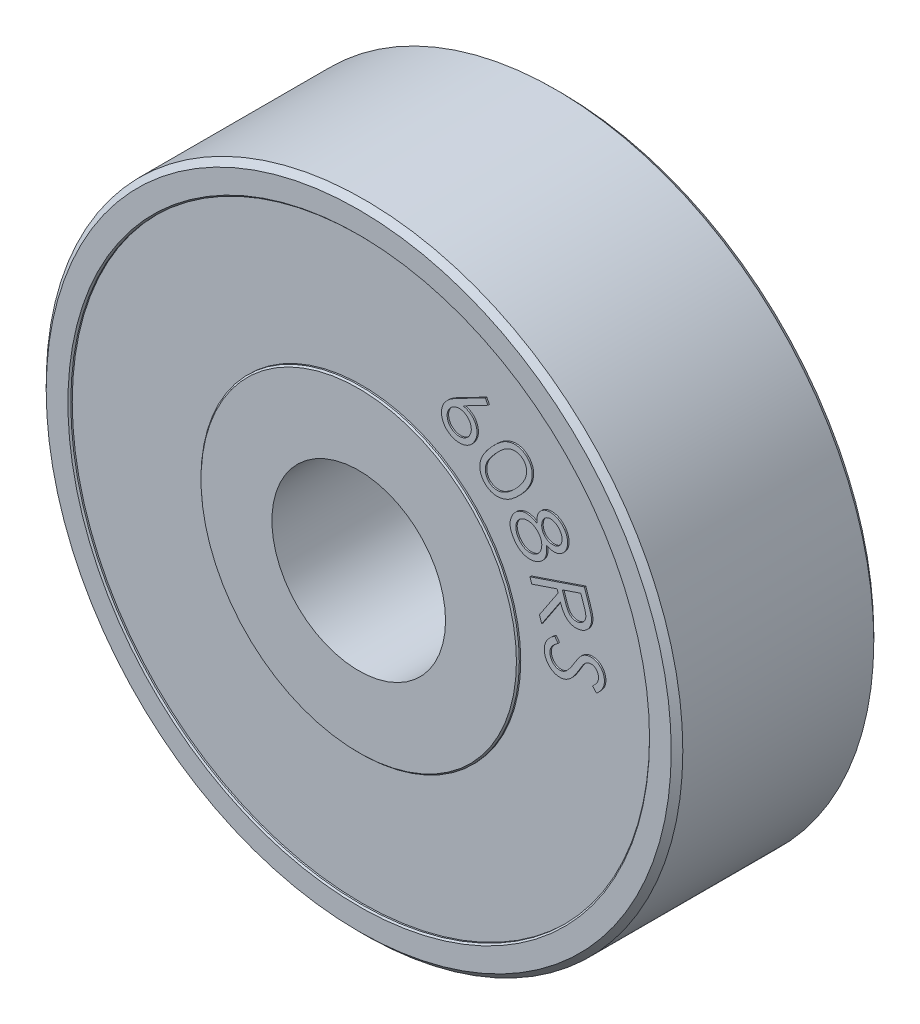
from build123d import *

# Parameters (mm, degrees)
SKETCH1_R           = 11
SKETCH1_R_2         = 4
BOSS_EXTRUDE1_DEPTH = 7
SKETCH2_R           = 10
SKETCH2_R_2         = 5.5
CUT_EXTRUDE1_DEPTH  = 0.1
CUT_EXTRUDE2_START  = -6.9
SKETCH2_2_R         = 10
SKETCH2_2_R_2       = 5.5
CUT_EXTRUDE2_DEPTH  = 0.1
CHAMFER1_SIZE       = 0.2
CHAMFER2_SIZE       = 0.05
BOSS_EXTRUDE2_DEPTH = 0.05
BOSS_EXTRUDE3_DEPTH = 0.05
SKETCH5_R           = 4.2
SKETCH5_R_2         = 3
BOSS_EXTRUDE4_DEPTH = 7


with BuildPart() as part:
    # Sketch1 → Boss-Extrude1 (new body)
    with BuildSketch(Plane.XY):
        Circle(SKETCH1_R)
        Circle(SKETCH1_R_2, mode=Mode.SUBTRACT)
    extrude(amount=BOSS_EXTRUDE1_DEPTH)

    # Sketch2 → Cut-Extrude1 (cut)
    with BuildSketch(Plane.XY.offset(7)):
        Circle(SKETCH2_R)
        Circle(SKETCH2_R_2, mode=Mode.SUBTRACT)
    extrude(amount=-CUT_EXTRUDE1_DEPTH, mode=Mode.SUBTRACT)

    # Sketch2<2> → Cut-Extrude2 (cut)
    with BuildSketch(Plane.XY.offset(7).offset(CUT_EXTRUDE2_START)):
        Circle(SKETCH2_2_R)
        Circle(SKETCH2_2_R_2, mode=Mode.SUBTRACT)
    extrude(amount=-CUT_EXTRUDE2_DEPTH, mode=Mode.SUBTRACT)

    # Chamfer1
    chamfer1_edges = [part.edges().sort_by_distance(p)[0] for p in [
        (-4, 0, 0),
        (-4, 0, 7),
        (-11, 0, 7),
        (-11, 0, 0),
    ]]
    chamfer(chamfer1_edges, length=CHAMFER1_SIZE)

    # Chamfer2
    chamfer2_edges = [part.edges().sort_by_distance(p)[0] for p in [
        (-5.5, 0, 7),
        (-10, 0, 7),
        (-10, 0, 0),
        (-5.5, 0, 0),
    ]]
    chamfer(chamfer2_edges, length=CHAMFER2_SIZE)

    # Sketch3 → Boss-Extrude2 (add)
    # profile 1 of 5: a face of its own
    with BuildSketch(Plane(origin=(0, 0, 0.1), x_dir=(-1, 0, 0), z_dir=(0, 0, -1))):
        with BuildLine():
            Line((6.723953336, 1.374086402), (6.841741797, 1.216634479))
            add(Edge.make_bspline(
                [(6.841741797, 1.216634479), (6.817573288, 1.199359859), (6.771292818, 1.166280551), (6.7089583, 1.113159264), (6.65797847, 1.058354359), (6.616042027, 1.003718422), (6.585197602, 0.947642508), (6.564677897, 0.890789262), (6.554264641, 0.832905218), (6.556279326, 0.794387119), (6.557286669, 0.775128069)],
                knots=[0, 0, 0, 0, 1.292055059, 2.474166467, 3.555169481, 4.54276915, 5.463097752, 6.326728609, 7.163364304, 8, 8, 8, 8], degree=3))
            add(Edge.make_bspline(
                [(6.557286669, 0.775128069), (6.559589482, 0.75889953), (6.564156821, 0.726712276), (6.577499183, 0.679747808), (6.597073867, 0.635157474), (6.621192779, 0.592867963), (6.650084971, 0.554531373), (6.683420565, 0.521824686), (6.71962411, 0.494193194), (6.759139635, 0.472574946), (6.800541147, 0.456589651), (6.843001787, 0.446611622), (6.8860034, 0.441689172), (6.914655203, 0.443624683), (6.929081541, 0.444599223)],
                knots=[0, 0, 0, 0, 1.065647424, 2.113576877, 3.164384275, 4.227051853, 5.274981306, 6.276492859, 7.256630379, 8.228879028, 9.197081163, 10.13494145, 11.060932943, 12, 12, 12, 12], degree=3))
            add(Edge.make_bspline(
                [(6.929081541, 0.444599223), (6.945519436, 0.447087772), (6.978756008, 0.45211949), (7.026704444, 0.470689174), (7.073741901, 0.496394668), (7.101970562, 0.519552155), (7.116581541, 0.531538325)],
                knots=[0, 0, 0, 0, 0.947990027, 1.916786729, 2.921741833, 4, 4, 4, 4], degree=3))
            add(Edge.make_bspline(
                [(7.116581541, 0.531538325), (7.127135431, 0.541011836), (7.149222449, 0.560837855), (7.181222658, 0.595056366), (7.214764351, 0.633812728), (7.249572833, 0.677474782), (7.285307224, 0.726179014), (7.3219168, 0.780016687), (7.360652209, 0.838318589), (7.38569458, 0.879600754), (7.398632823, 0.900929351)],
                knots=[0, 0, 0, 0, 0.729441018, 1.526562937, 2.408317325, 3.366672661, 4.398852945, 5.515801495, 6.716528806, 8, 8, 8, 8], degree=3))
            add(Edge.make_bspline(
                [(7.398632823, 0.900929351), (7.411481182, 0.922096096), (7.436017587, 0.962518055), (7.472820572, 1.019379999), (7.50609449, 1.07074534), (7.537338687, 1.115557702), (7.565826722, 1.154147196), (7.591394823, 1.186795914), (7.614407064, 1.213420818), (7.629713327, 1.228338761), (7.636613592, 1.235063966)],
                knots=[0, 0, 0, 0, 1.445236574, 2.759956344, 3.953419532, 5.017350228, 5.948124348, 6.752849745, 7.43776821, 8, 8, 8, 8], degree=3))
            add(Edge.make_bspline(
                [(7.636613592, 1.235063966), (7.647453442, 1.244543907), (7.668850152, 1.263256302), (7.702463752, 1.288692966), (7.737555465, 1.310371795), (7.773613033, 1.328839241), (7.810780176, 1.344090457), (7.848714771, 1.356654507), (7.887907457, 1.365581106), (7.91448874, 1.368839266), (7.927879618, 1.370480633)],
                knots=[0, 0, 0, 0, 1.056756624, 2.085925105, 3.08957304, 4.080262677, 5.055903979, 6.035378084, 7.010280581, 8, 8, 8, 8], degree=3))
            add(Edge.make_bspline(
                [(7.927879618, 1.370480633), (7.948981269, 1.371870248), (7.990587385, 1.37461015), (8.052279005, 1.368496586), (8.111981804, 1.355515205), (8.168798048, 1.333504491), (8.222511066, 1.304967414), (8.271642008, 1.26880591), (8.315398275, 1.225611054), (8.35382237, 1.176261797), (8.385992991, 1.122092785), (8.41166226, 1.064244335), (8.429536588, 1.002885194), (8.435353033, 0.960458902), (8.438296284, 0.938990248)],
                knots=[0, 0, 0, 0, 1.01991207, 2.010960161, 2.982781706, 3.962746851, 4.943984954, 5.912890685, 6.898148972, 7.904611514, 8.925685622, 9.933656005, 10.954383679, 12, 12, 12, 12], degree=3))
            add(Edge.make_bspline(
                [(8.438296284, 0.938990248), (8.439905173, 0.916018968), (8.443100643, 0.870394895), (8.435954309, 0.802226976), (8.421251944, 0.735375989), (8.401131857, 0.681031699), (8.37977872, 0.638088379), (8.360564, 0.604548729), (8.337040201, 0.570775496), (8.310670734, 0.53558058), (8.279863744, 0.500254418), (8.246489716, 0.463106616), (8.208609747, 0.426121993), (8.181946924, 0.401530075), (8.168264233, 0.38891012)],
                knots=[0, 0, 0, 0, 1.294867467, 2.571782184, 3.843746611, 5.143215914, 5.822746795, 6.543964101, 7.318006915, 8.13942962, 9.019769218, 9.956863672, 10.951513765, 12, 12, 12, 12], degree=3))
            Line((8.168264233, 0.38891012), (8.029642438, 0.537547941))
            add(Edge.make_bspline(
                [(8.029642438, 0.537547941), (8.040491364, 0.547797716), (8.061430909, 0.567580842), (8.091198861, 0.596726402), (8.1177117, 0.624750316), (8.140998798, 0.651703899), (8.161430413, 0.677149832), (8.178807729, 0.701361339), (8.193307277, 0.724006553), (8.208313949, 0.752376209), (8.222111687, 0.78797107), (8.232490263, 0.831773931), (8.237254627, 0.876823898), (8.235338696, 0.906937777), (8.234370002, 0.922163325)],
                knots=[0, 0, 0, 0, 1.182699611, 2.282732375, 3.300866298, 4.238668036, 5.104698929, 5.88587987, 6.599324344, 7.233663973, 8.426546453, 9.612413994, 10.792838817, 12, 12, 12, 12], degree=3))
            add(Edge.make_bspline(
                [(8.234370002, 0.922163325), (8.231544844, 0.941132772), (8.226095153, 0.97772457), (8.207511221, 1.029103552), (8.179226125, 1.07342249), (8.143481188, 1.110786437), (8.101919482, 1.139998909), (8.056290048, 1.160326247), (8.006902954, 1.169811767), (7.973443836, 1.168186943), (7.956325131, 1.167355633)],
                knots=[0, 0, 0, 0, 1.109513479, 2.140235993, 3.138523126, 4.134648421, 5.117916045, 6.063936821, 7.00945106, 8, 8, 8, 8], degree=3))
            add(Edge.make_bspline(
                [(7.956325131, 1.167355633), (7.945745182, 1.165793238), (7.92452439, 1.162659454), (7.893216116, 1.154810012), (7.863019919, 1.142853978), (7.833191485, 1.128051735), (7.803915641, 1.108026169), (7.773495168, 1.083650001), (7.743435661, 1.052289809), (7.723571823, 1.029230065), (7.713136028, 1.017115248)],
                knots=[0, 0, 0, 0, 0.872627401, 1.750277355, 2.626708255, 3.518723759, 4.461878059, 5.515567722, 6.694762481, 8, 8, 8, 8], degree=3))
            add(Edge.make_bspline(
                [(7.713136028, 1.017115248), (7.709759885, 1.012601252), (7.701657657, 1.00176835), (7.688608104, 0.982001066), (7.672276268, 0.956433232), (7.65262288, 0.924978085), (7.629276842, 0.887948617), (7.60342511, 0.84439932), (7.573757222, 0.795347482), (7.552995234, 0.760582288), (7.54206231, 0.742275505)],
                knots=[0, 0, 0, 0, 0.417704147, 1.002426291, 1.754721007, 2.666443671, 3.751275867, 4.998903859, 6.419671761, 8, 8, 8, 8], degree=3))
            add(Edge.make_bspline(
                [(7.54206231, 0.742275505), (7.528720878, 0.72014766), (7.502869753, 0.677271475), (7.462909444, 0.616494005), (7.424908705, 0.560118495), (7.386533341, 0.509633022), (7.349495907, 0.463846731), (7.313037636, 0.423278472), (7.277439614, 0.387815365), (7.231706317, 0.348414155), (7.174122265, 0.307697522), (7.102778014, 0.269865497), (7.029575045, 0.243643782), (6.979473401, 0.23602383), (6.954722566, 0.232259479)],
                knots=[0, 0, 0, 0, 1.151589416, 2.231385892, 3.241866087, 4.181198595, 5.056967968, 5.86622306, 6.611257172, 7.295010099, 8.555133183, 9.745337415, 10.8861687, 12, 12, 12, 12], degree=3))
            add(Edge.make_bspline(
                [(6.954722566, 0.232259479), (6.937104145, 0.230954156), (6.902273291, 0.228373588), (6.850287945, 0.230996996), (6.799553841, 0.238604602), (6.7498888, 0.251362609), (6.70178582, 0.270191913), (6.654518449, 0.293243368), (6.609132064, 0.322693373), (6.565113537, 0.35621304), (6.524107945, 0.393956855), (6.487534332, 0.434933646), (6.45562657, 0.478557564), (6.428202178, 0.524760922), (6.405676349, 0.573922386), (6.388114701, 0.625763552), (6.37509852, 0.680239147), (6.370249322, 0.717645223), (6.367783464, 0.73666653)],
                knots=[0, 0, 0, 0, 0.985637329, 1.948562123, 2.898699275, 3.846375535, 4.804641011, 5.778360361, 6.777444169, 7.819911255, 8.864722404, 9.88397061, 10.881717925, 11.877903731, 12.878850076, 13.895148367, 14.929665032, 16, 16, 16, 16], degree=3))
            add(Edge.make_bspline(
                [(6.367783464, 0.73666653), (6.366427586, 0.751479961), (6.36374365, 0.780802889), (6.364781078, 0.824712107), (6.366958187, 0.867892434), (6.373888092, 0.910243045), (6.38267062, 0.952061727), (6.395985544, 0.99277455), (6.410879198, 1.033227048), (6.430041569, 1.072638466), (6.452506534, 1.111705681), (6.479103013, 1.150236727), (6.509821859, 1.188344837), (6.544257517, 1.226550474), (6.583270723, 1.264064543), (6.626226549, 1.301327262), (6.673295047, 1.338362343), (6.706747289, 1.361952754), (6.723953336, 1.374086402)],
                knots=[0, 0, 0, 0, 0.924783812, 1.830593555, 2.729938474, 3.612542721, 4.497647048, 5.385983185, 6.274940971, 7.178116819, 8.108855036, 9.07694148, 10.087910257, 11.152769032, 12.275211649, 13.45327497, 14.690100631, 16, 16, 16, 16], degree=3))
        make_face()
    # profile 2 of 5: a face of its own
    with BuildSketch(Plane(origin=(0, 0, 0.1), x_dir=(-1, 0, 0), z_dir=(0, 0, -1))):
        with BuildLine():
            Line((7.746137114, 3.357649879), (7.872739678, 2.983451161))
            add(Edge.make_bspline(
                [(7.872739678, 2.983451161), (7.881059185, 2.958357449), (7.896967784, 2.910373143), (7.919192418, 2.841249827), (7.93827157, 2.778162874), (7.954988951, 2.721116942), (7.968277975, 2.670083531), (7.97810167, 2.624967975), (7.986304921, 2.586220173), (7.989206196, 2.562134117), (7.99052814, 2.551159494)],
                knots=[0, 0, 0, 0, 1.41401025, 2.703876705, 3.883389485, 4.939117467, 5.883308228, 6.703003456, 7.409033675, 8, 8, 8, 8], degree=3))
            add(Edge.make_bspline(
                [(7.99052814, 2.551159494), (7.991680371, 2.536346044), (7.993961878, 2.507014281), (7.99355178, 2.463189389), (7.989536296, 2.420458725), (7.982244147, 2.378807362), (7.971867446, 2.338150413), (7.957859366, 2.298427821), (7.940049121, 2.259949253), (7.919392559, 2.222682043), (7.895267023, 2.187520322), (7.868522083, 2.15435442), (7.838146422, 2.124526727), (7.805654899, 2.096319063), (7.769505392, 2.071821996), (7.730676725, 2.049581161), (7.689074117, 2.029824145), (7.65969703, 2.019263938), (7.644774935, 2.013899879)],
                knots=[0, 0, 0, 0, 1.027353843, 2.034239082, 3.026914782, 3.992754084, 4.956116645, 5.926055136, 6.901519887, 7.885736109, 8.869562139, 9.847691085, 10.827432488, 11.810304063, 12.819812835, 13.841795782, 14.903739854, 16, 16, 16, 16], degree=3))
            add(Edge.make_bspline(
                [(7.644774935, 2.013899879), (7.619571721, 2.006225956), (7.570483848, 1.991279587), (7.495245456, 1.981482942), (7.421726968, 1.981550073), (7.350113043, 1.99285135), (7.28164526, 2.01459628), (7.217050526, 2.046407449), (7.157909987, 2.089546729), (7.111856988, 2.132170274), (7.078246075, 2.172604827), (7.052872874, 2.206693439), (7.028502864, 2.24470871), (7.00542963, 2.286885007), (6.981948203, 2.332291093), (6.960215509, 2.382102891), (6.938952909, 2.435460163), (6.925647847, 2.472458787), (6.918813396, 2.491463981)],
                knots=[0, 0, 0, 0, 1.278263464, 2.489652168, 3.670679834, 4.839936614, 5.997393751, 7.149490657, 8.321732671, 9.542815408, 10.187555536, 10.874109659, 11.606713321, 12.379429923, 13.209421677, 14.089665205, 15.018712606, 16, 16, 16, 16], degree=3))
            Line((6.918813396, 2.491463981), (6.274181986, 1.519909494))
            Line((6.274181986, 1.519909494), (6.195656345, 1.75268193))
            Line((6.195656345, 1.75268193), (6.840688396, 2.722633853))
            Line((6.840688396, 2.722633853), (6.804630704, 2.829605007))
            Line((6.804630704, 2.829605007), (5.931233268, 2.53393193))
            Line((5.931233268, 2.53393193), (5.867531345, 2.721832571))
            Line((5.867531345, 2.721832571), (7.746137114, 3.357649879))
        make_face()
        with BuildLine():
            Line((7.625944806, 3.107649879), (6.987323011, 2.891303725))
            Line((6.987323011, 2.891303725), (7.093893524, 2.567585776))
            add(Edge.make_bspline(
                [(7.093893524, 2.567585776), (7.099141602, 2.552460366), (7.109268083, 2.523274973), (7.12546665, 2.481526975), (7.141165795, 2.442969417), (7.157905934, 2.408224542), (7.173577508, 2.37635315), (7.19005439, 2.34833638), (7.206517147, 2.323717963), (7.228098548, 2.295648952), (7.257158343, 2.265709238), (7.296463649, 2.236869944), (7.338965987, 2.214103265), (7.38510297, 2.199047445), (7.432884658, 2.190547052), (7.481570808, 2.189590563), (7.530612026, 2.194710922), (7.562229046, 2.204464605), (7.578268524, 2.209412699)],
                knots=[0, 0, 0, 0, 1.118554581, 2.158318542, 3.128777667, 4.026236993, 4.852521549, 5.609511046, 6.2953485, 6.920617761, 8.081985124, 9.196171859, 10.314843201, 11.436157874, 12.572935431, 13.69304583, 14.829670183, 16, 16, 16, 16], degree=3))
            add(Edge.make_bspline(
                [(7.578268524, 2.209412699), (7.59342902, 2.215251964), (7.62342383, 2.226804859), (7.664579795, 2.251684726), (7.701464878, 2.282014563), (7.733367565, 2.317620085), (7.759719917, 2.357194019), (7.780045409, 2.399320856), (7.793065142, 2.44385535), (7.798012121, 2.482767203), (7.798617957, 2.516069958), (7.796430694, 2.544330853), (7.791830588, 2.575579595), (7.785411015, 2.609926292), (7.776957572, 2.647370858), (7.766058218, 2.687842945), (7.752740917, 2.731460489), (7.742856393, 2.761514748), (7.737723652, 2.777121033)],
                knots=[0, 0, 0, 0, 1.157480747, 2.290057996, 3.413820966, 4.554229024, 5.688088466, 6.796349954, 7.878911532, 8.984095935, 9.584534887, 10.253304793, 11.003966908, 11.837573395, 12.74613744, 13.742422656, 14.827707137, 16, 16, 16, 16], degree=3))
            Line((7.737723652, 2.777121033), (7.625944806, 3.107649879))
        make_face(mode=Mode.SUBTRACT)
    # profile 3 of 5: a face of its own
    with BuildSketch(Plane(origin=(0, 0, 0.1), x_dir=(-1, 0, 0), z_dir=(0, 0, -1))):
        with BuildLine():
            add(Edge.make_bspline(
                [(6.436645373, 3.958851709), (6.438849744, 3.940573746), (6.443153326, 3.904889774), (6.446080097, 3.852458084), (6.447345332, 3.802571834), (6.444615596, 3.755237655), (6.440242818, 3.710182835), (6.431945321, 3.667690701), (6.421801836, 3.627540907), (6.408467872, 3.589869698), (6.392118978, 3.554645749), (6.374421381, 3.520656156), (6.353059749, 3.489126668), (6.330588283, 3.458332588), (6.304473045, 3.429986163), (6.276658623, 3.402650225), (6.246016539, 3.377299569), (6.224148017, 3.36201487), (6.213087681, 3.354284402)],
                knots=[0, 0, 0, 0, 1.290890309, 2.520198396, 3.681805585, 4.788490099, 5.843551436, 6.853927339, 7.821726867, 8.74603337, 9.651448064, 10.544029729, 11.429902383, 12.319727641, 13.215057227, 14.129151139, 15.053789794, 16, 16, 16, 16], degree=3))
            add(Edge.make_bspline(
                [(6.213087681, 3.354284402), (6.197080539, 3.344144505), (6.165376402, 3.324061175), (6.115609733, 3.298721518), (6.064443052, 3.278646051), (6.012154311, 3.263322512), (5.958510855, 3.252871046), (5.903673026, 3.247212262), (5.847609117, 3.246868388), (5.810160039, 3.250090216), (5.791212681, 3.251720299)],
                knots=[0, 0, 0, 0, 1.02459754, 2.029343036, 3.015319328, 3.993724459, 4.972689464, 5.967517749, 6.971665777, 8, 8, 8, 8], degree=3))
            add(Edge.make_bspline(
                [(5.791212681, 3.251720299), (5.76812279, 3.255152686), (5.722105673, 3.26199328), (5.655371216, 3.282467937), (5.591465368, 3.310695655), (5.530691013, 3.347287029), (5.472409223, 3.391028314), (5.417139616, 3.44291569), (5.364964002, 3.502778785), (5.333693598, 3.547097948), (5.317654988, 3.569829274)],
                knots=[0, 0, 0, 0, 0.94927729, 1.891867025, 2.831441269, 3.787189233, 4.773456595, 5.792841766, 6.867947176, 8, 8, 8, 8], degree=3))
            add(Edge.make_bspline(
                [(5.317654988, 3.569829274), (5.303063571, 3.592276258), (5.274661246, 3.635969511), (5.240442419, 3.70396576), (5.213126694, 3.770723532), (5.193673612, 3.836759996), (5.18189304, 3.902041339), (5.177652501, 3.9664582), (5.181746591, 4.030123994), (5.193666901, 4.092147537), (5.210811163, 4.152011519), (5.232533781, 4.208453206), (5.257704373, 4.261497857), (5.287473484, 4.310315858), (5.320899663, 4.355598373), (5.358263051, 4.396995678), (5.399718813, 4.434649249), (5.43013903, 4.456340746), (5.445459476, 4.467265171)],
                knots=[0, 0, 0, 0, 1.265189782, 2.462703114, 3.593198436, 4.67234407, 5.711673085, 6.724080211, 7.71757927, 8.719632106, 9.70506986, 10.658584755, 11.576575664, 12.477685061, 13.358041525, 14.234425087, 15.110808649, 16, 16, 16, 16], degree=3))
            add(Edge.make_bspline(
                [(5.445459476, 4.467265171), (5.456987966, 4.474624406), (5.480000329, 4.489314395), (5.515649837, 4.508441139), (5.552366299, 4.524126629), (5.589327481, 4.537519912), (5.627481553, 4.547343512), (5.665928122, 4.555312832), (5.705401353, 4.558925918), (5.745399858, 4.560814177), (5.786673455, 4.559096182), (5.829078302, 4.554049573), (5.872697014, 4.544281293), (5.91778122, 4.532182679), (5.964098431, 4.515785424), (6.011833619, 4.496274612), (6.060588671, 4.472457347), (6.093098017, 4.454707355), (6.109722296, 4.445630556)],
                knots=[0, 0, 0, 0, 0.931334836, 1.859065266, 2.751202648, 3.648748233, 4.533436264, 5.43245535, 6.319384756, 7.229651734, 8.158095254, 9.129430785, 10.133761898, 11.19951572, 12.306952597, 13.477470392, 14.710056011, 16, 16, 16, 16], degree=3))
            add(Edge.make_bspline(
                [(6.109722296, 4.445630556), (6.107482301, 4.47205299), (6.10313889, 4.52328682), (6.107287375, 4.598282233), (6.11985051, 4.668288878), (6.14164351, 4.732865757), (6.171434346, 4.791786736), (6.208476731, 4.844446438), (6.252045054, 4.891203726), (6.28610488, 4.91622277), (6.303231911, 4.928803633)],
                knots=[0, 0, 0, 0, 1.159116483, 2.247558892, 3.275615725, 4.262372356, 5.218835671, 6.154236364, 7.07185513, 8, 8, 8, 8], degree=3))
            add(Edge.make_bspline(
                [(6.303231911, 4.928803633), (6.321754889, 4.940084937), (6.359014229, 4.962777505), (6.421256217, 4.986222737), (6.488036273, 5.000993457), (6.558445944, 5.007117844), (6.630670913, 5.005090507), (6.702669609, 4.992413163), (6.77329377, 4.969774079), (6.841463499, 4.937151075), (6.906181416, 4.896456921), (6.965941656, 4.848096386), (7.019799943, 4.792057066), (7.050247347, 4.749841495), (7.065651783, 4.72848312)],
                knots=[0, 0, 0, 0, 0.892779067, 1.795842916, 2.727080536, 3.70581188, 4.703144711, 5.698163754, 6.710047702, 7.752069251, 8.806330382, 9.855631886, 10.91508709, 12, 12, 12, 12], degree=3))
            add(Edge.make_bspline(
                [(7.065651783, 4.72848312), (7.079336383, 4.706774175), (7.106401224, 4.663839111), (7.136261198, 4.594226894), (7.157475004, 4.522286133), (7.168858659, 4.44845505), (7.171401759, 4.374581199), (7.164611604, 4.302250625), (7.148558493, 4.232231558), (7.122885922, 4.165630452), (7.089294662, 4.103906053), (7.0495902, 4.047721731), (7.002341174, 3.999113654), (6.966283703, 3.972535032), (6.948263963, 3.95925235)],
                knots=[0, 0, 0, 0, 1.068771019, 2.113771646, 3.146516798, 4.18939315, 5.220229497, 6.221594843, 7.210477599, 8.206485729, 9.188317762, 10.134173663, 11.067552274, 12, 12, 12, 12], degree=3))
            add(Edge.make_bspline(
                [(6.948263963, 3.95925235), (6.92948131, 3.947579211), (6.892704816, 3.924723167), (6.832726752, 3.900840341), (6.770949722, 3.886814804), (6.707208907, 3.88185386), (6.641795956, 3.887028294), (6.57452711, 3.90142974), (6.505301459, 3.925243395), (6.460060234, 3.947389739), (6.436645373, 3.958851709)],
                knots=[0, 0, 0, 0, 0.981875121, 1.922514633, 2.854567088, 3.789622669, 4.754286786, 5.76174218, 6.841576559, 8, 8, 8, 8], degree=3))
        make_face()
        with BuildLine():
            add(Edge.make_bspline(
                [(6.899786399, 4.627521581), (6.89206632, 4.638457323), (6.87685916, 4.659998761), (6.851731015, 4.689696603), (6.824543522, 4.715861262), (6.79632334, 4.739189166), (6.766173857, 4.759065259), (6.734647119, 4.775820377), (6.701543011, 4.789622008), (6.667263629, 4.799834203), (6.632827413, 4.807110393), (6.598864764, 4.810677554), (6.565845271, 4.811257308), (6.533573133, 4.808043896), (6.502305027, 4.801150813), (6.471895114, 4.791090338), (6.442508709, 4.777396374), (6.423983999, 4.765933971), (6.414610117, 4.760133761)],
                knots=[0, 0, 0, 0, 1.147797877, 2.260954539, 3.330167184, 4.38025149, 5.396817843, 6.421610434, 7.438370352, 8.467442645, 9.485040915, 10.452679454, 11.391973248, 12.312859485, 13.227240642, 14.132754951, 15.055135845, 16, 16, 16, 16], degree=3))
            add(Edge.make_bspline(
                [(6.414610117, 4.760133761), (6.405774199, 4.753786345), (6.388108367, 4.741095827), (6.364373565, 4.718498267), (6.343734102, 4.693036444), (6.324762197, 4.66560438), (6.309508042, 4.635122756), (6.296405059, 4.602338894), (6.286620035, 4.566820361), (6.27902636, 4.529487679), (6.274755334, 4.491152689), (6.273205383, 4.453199531), (6.276275975, 4.416049243), (6.282273469, 4.379861769), (6.29134367, 4.344469632), (6.304515391, 4.310097751), (6.320673305, 4.276359421), (6.334378057, 4.255189882), (6.341292809, 4.244508761)],
                knots=[0, 0, 0, 0, 0.908844192, 1.81707094, 2.729132775, 3.645761934, 4.599514883, 5.571907187, 6.593318126, 7.675011067, 8.753876802, 9.815092739, 10.84525358, 11.863975947, 12.879511735, 13.893573417, 14.937199413, 16, 16, 16, 16], degree=3))
            add(Edge.make_bspline(
                [(6.341292809, 4.244508761), (6.350814274, 4.231255034), (6.369827412, 4.204789049), (6.404691636, 4.170598056), (6.443344082, 4.140394154), (6.485652106, 4.115036742), (6.53091205, 4.095367527), (6.577788532, 4.082025189), (6.625777609, 4.074990316), (6.673984131, 4.075405122), (6.721007008, 4.080627131), (6.765184168, 4.092077638), (6.806448491, 4.107815252), (6.831074035, 4.122859441), (6.843296014, 4.130326068)],
                knots=[0, 0, 0, 0, 1.029778083, 2.056334151, 3.072742447, 4.125103068, 5.164692881, 6.18264204, 7.197261409, 8.21856438, 9.221531217, 10.179595353, 11.096509409, 12, 12, 12, 12], degree=3))
            add(Edge.make_bspline(
                [(6.843296014, 4.130326068), (6.851446438, 4.13616324), (6.867594435, 4.147728114), (6.88939698, 4.168131937), (6.90904658, 4.190508833), (6.92640353, 4.215277105), (6.941639015, 4.242075679), (6.954455745, 4.271261696), (6.965288178, 4.302452796), (6.973600755, 4.335686204), (6.979511889, 4.370209731), (6.980683648, 4.405777115), (6.977172407, 4.441591107), (6.970465098, 4.478043747), (6.9591051, 4.514969221), (6.943248573, 4.552252268), (6.923519635, 4.590151684), (6.907856867, 4.614813977), (6.899786399, 4.627521581)],
                knots=[0, 0, 0, 0, 0.860567069, 1.704995385, 2.558804371, 3.415153889, 4.298967395, 5.203031682, 6.150124742, 7.132495547, 8.143595732, 9.153914339, 10.17923786, 11.230179396, 12.333615959, 13.490750709, 14.707072956, 16, 16, 16, 16], degree=3))
        make_face(mode=Mode.SUBTRACT)
        with BuildLine():
            add(Edge.make_bspline(
                [(6.192654988, 4.141544017), (6.183073031, 4.155401294), (6.164227572, 4.182655302), (6.131187317, 4.218933327), (6.097015473, 4.252070626), (6.059989677, 4.280785033), (6.020837675, 4.305788703), (5.978908288, 4.326108106), (5.934953683, 4.342757084), (5.889255118, 4.354794419), (5.843074833, 4.363522847), (5.797427161, 4.366805064), (5.753115121, 4.366894985), (5.710232395, 4.361231726), (5.668413788, 4.352462102), (5.628232574, 4.337906769), (5.58882321, 4.320171181), (5.564407056, 4.304523989), (5.552029988, 4.296592094)],
                knots=[0, 0, 0, 0, 1.103096915, 2.169532516, 3.209705979, 4.22005898, 5.235178716, 6.249127762, 7.268541052, 8.31114268, 9.343069619, 10.344088993, 11.307028603, 12.241865975, 13.174241085, 14.101672058, 15.037697202, 16, 16, 16, 16], degree=3))
            add(Edge.make_bspline(
                [(5.552029988, 4.296592094), (5.53739373, 4.285920167), (5.508158373, 4.264603408), (5.470459325, 4.225147952), (5.438160928, 4.180583136), (5.411429753, 4.131524815), (5.391128257, 4.078821031), (5.379712135, 4.02334043), (5.375573245, 3.966204794), (5.379709706, 3.907692931), (5.391978104, 3.848519155), (5.411845955, 3.789219006), (5.439605058, 3.729865997), (5.463581076, 3.692173419), (5.475908194, 3.672794017)],
                knots=[0, 0, 0, 0, 0.926109246, 1.849867156, 2.780058085, 3.737943589, 4.703270699, 5.660960876, 6.627667837, 7.628486545, 8.654526651, 9.714225142, 10.824783286, 12, 12, 12, 12], degree=3))
            add(Edge.make_bspline(
                [(5.475908194, 3.672794017), (5.486060461, 3.658170197), (5.505883669, 3.629615884), (5.539352829, 3.591150094), (5.574498341, 3.557119283), (5.611193238, 3.52754691), (5.649610266, 3.502113814), (5.690285635, 3.482258235), (5.73254201, 3.466467844), (5.776087466, 3.455386323), (5.819965834, 3.44854851), (5.863310687, 3.446190652), (5.905570882, 3.447721693), (5.946649447, 3.453327605), (5.986515083, 3.463003588), (6.025261611, 3.476638949), (6.062787941, 3.494832298), (6.086485292, 3.509769369), (6.098504347, 3.517345299)],
                knots=[0, 0, 0, 0, 1.19035752, 2.32427924, 3.40484362, 4.459799014, 5.473418872, 6.48040078, 7.481219341, 8.486773131, 9.481309882, 10.447796045, 11.386669185, 12.306601008, 13.216804754, 14.126789189, 15.049926509, 16, 16, 16, 16], degree=3))
            add(Edge.make_bspline(
                [(6.098504347, 3.517345299), (6.109623379, 3.525413647), (6.131612455, 3.541369668), (6.161538623, 3.568937135), (6.18821179, 3.599437638), (6.210866349, 3.633334346), (6.230793072, 3.669716469), (6.247216973, 3.709047676), (6.259874558, 3.751393122), (6.269542145, 3.795841921), (6.274911413, 3.841443699), (6.276921551, 3.886781556), (6.273360853, 3.931306877), (6.266335015, 3.975088203), (6.254596548, 4.018173699), (6.238424813, 4.06039773), (6.21802423, 4.101939076), (6.201197342, 4.128208206), (6.192654988, 4.141544017)],
                knots=[0, 0, 0, 0, 0.942671861, 1.864234432, 2.78725575, 3.718123832, 4.657802721, 5.631928245, 6.638488188, 7.688830978, 8.751153965, 9.788000563, 10.799352584, 11.812407604, 12.828984143, 13.859322421, 14.913261601, 16, 16, 16, 16], degree=3))
        make_face(mode=Mode.SUBTRACT)
    # profile 4 of 5: a face of its own
    with BuildSketch(Plane(origin=(0, 0, 0.1), x_dir=(-1, 0, 0), z_dir=(0, 0, -1))):
        with BuildLine():
            add(Edge.make_bspline(
                [(4.543033426, 5.949335529), (4.564943157, 5.972693181), (4.607527355, 6.018091587), (4.67157506, 6.0821776), (4.733665606, 6.140505217), (4.794137626, 6.192741517), (4.85293655, 6.238729797), (4.909649751, 6.279135227), (4.964441144, 6.313866459), (5.018164906, 6.342452083), (5.070566701, 6.366205448), (5.122024451, 6.38603643), (5.172895525, 6.401712181), (5.223134838, 6.413290127), (5.272621026, 6.421532789), (5.321665929, 6.425568094), (5.370160168, 6.42549656), (5.417968316, 6.42189385), (5.464631842, 6.414853045), (5.509827437, 6.403785557), (5.553710443, 6.389848585), (5.596047144, 6.372253298), (5.636808987, 6.351171515), (5.676066811, 6.327121226), (5.714074787, 6.299926787), (5.737519741, 6.279144916), (5.749363554, 6.268646427)],
                knots=[0, 0, 0, 0, 1.642537938, 3.192470103, 4.646338539, 6.011168142, 7.289605298, 8.473669563, 9.581665276, 10.614373007, 11.59226402, 12.531086133, 13.441104306, 14.320069679, 15.173659948, 16.012137794, 16.84096325, 17.65841702, 18.469272155, 19.258427056, 20.042601694, 20.82874835, 21.606886513, 22.39398752, 23.188682081, 24, 24, 24, 24], degree=3))
            add(Edge.make_bspline(
                [(5.749363554, 6.268646427), (5.760911716, 6.257617316), (5.783832443, 6.2357268), (5.814606127, 6.199685182), (5.842763625, 6.162273296), (5.86720813, 6.122744115), (5.888632845, 6.081687155), (5.906688759, 6.038659944), (5.921436917, 5.993756214), (5.933125957, 5.947322605), (5.941123235, 5.899359884), (5.945576238, 5.850210478), (5.945937318, 5.799696325), (5.942178582, 5.748167993), (5.934948076, 5.695283356), (5.923723996, 5.64133292), (5.908257359, 5.586132596), (5.889035669, 5.529625786), (5.865374627, 5.471491833), (5.83582998, 5.412255968), (5.80126516, 5.351314775), (5.761491532, 5.288687708), (5.716170301, 5.224741752), (5.665349958, 5.159251463), (5.609380215, 5.092013278), (5.569231642, 5.047489171), (5.5486424, 5.024656042)],
                knots=[0, 0, 0, 0, 0.812736739, 1.613115341, 2.410193159, 3.195255584, 3.977011722, 4.766451224, 5.568648116, 6.381840011, 7.202505524, 8.042362829, 8.892510741, 9.771967907, 10.671265438, 11.608935862, 12.575845681, 13.588824347, 14.647177854, 15.769502049, 16.957239641, 18.213799721, 19.545973321, 20.947120805, 22.434403522, 24, 24, 24, 24], degree=3))
            add(Edge.make_bspline(
                [(5.5486424, 5.024656042), (5.527680493, 5.002353903), (5.486797486, 4.958856979), (5.424765374, 4.897538301), (5.363751907, 4.841756827), (5.304193874, 4.791136914), (5.245683972, 4.746127832), (5.188196251, 4.706632475), (5.131917607, 4.672564327), (5.076622511, 4.643827313), (5.022302089, 4.620150633), (4.968866404, 4.60056073), (4.916443523, 4.584153257), (4.864386266, 4.572744454), (4.813189003, 4.564345172), (4.762509713, 4.561020629), (4.712689965, 4.560768112), (4.663807528, 4.564917701), (4.616099552, 4.572413487), (4.569931105, 4.58374163), (4.525340014, 4.598193132), (4.482211508, 4.615751886), (4.440882307, 4.637302377), (4.400706003, 4.661523567), (4.362510463, 4.689746565), (4.338690087, 4.710774866), (4.326687272, 4.721370786)],
                knots=[0, 0, 0, 0, 1.559433233, 3.041436978, 4.443008781, 5.770818333, 7.022943957, 8.202580838, 9.32288808, 10.372875569, 11.375398524, 12.339881119, 13.271916542, 14.171621232, 15.053181812, 15.912749435, 16.756523382, 17.589472185, 18.409479342, 19.214872608, 20.008917662, 20.796169375, 21.584390954, 22.381462505, 23.184437513, 24, 24, 24, 24], degree=3))
            add(Edge.make_bspline(
                [(4.326687272, 4.721370786), (4.315260387, 4.732257291), (4.292582092, 4.753863126), (4.262524999, 4.789474989), (4.234216651, 4.825811541), (4.210591491, 4.864827354), (4.189388006, 4.905106752), (4.171852571, 4.947252998), (4.157409917, 4.991049596), (4.146081336, 5.036416821), (4.1385724, 5.083328133), (4.134475716, 5.131406743), (4.134526669, 5.180589449), (4.138668218, 5.230653261), (4.146378676, 5.281762522), (4.157589801, 5.333992266), (4.172890384, 5.387243797), (4.192316993, 5.44187928), (4.216511887, 5.49808747), (4.245828348, 5.556425299), (4.281385112, 5.616628969), (4.322888369, 5.67887757), (4.369244831, 5.744006213), (4.421956893, 5.810719564), (4.480129534, 5.879757147), (4.521656172, 5.925690016), (4.543033426, 5.949335529)],
                knots=[0, 0, 0, 0, 0.809667474, 1.606901415, 2.389915423, 3.171938179, 3.944739181, 4.725317868, 5.512374, 6.310580304, 7.123290289, 7.948912628, 8.785395908, 9.645186643, 10.525642855, 11.437417869, 12.385812245, 13.368196359, 14.41253519, 15.525600646, 16.717987141, 17.999697683, 19.365829755, 20.821103961, 22.363554732, 24, 24, 24, 24], degree=3))
        make_face()
        with BuildLine():
            add(Edge.make_bspline(
                [(4.679251375, 5.818325914), (4.660851677, 5.798119355), (4.625169821, 5.75893352), (4.575066406, 5.700527005), (4.530060028, 5.644381866), (4.490109119, 5.590608243), (4.454150268, 5.539934716), (4.423546398, 5.49144367), (4.398220443, 5.445165553), (4.377241144, 5.40129025), (4.35988931, 5.359114478), (4.347091963, 5.31763911), (4.335718979, 5.277328241), (4.328855361, 5.237439496), (4.323935339, 5.198395489), (4.323658489, 5.159929724), (4.324705927, 5.122099941), (4.332062828, 5.073644615), (4.346039936, 5.016229297), (4.372941953, 4.953168665), (4.40806014, 4.896592751), (4.438775126, 4.865487268), (4.454091118, 4.849976555)],
                knots=[0, 0, 0, 0, 1.475488141, 2.861359785, 4.154121984, 5.359730204, 6.477947551, 7.508249804, 8.453740252, 9.324547233, 10.133287385, 10.913161477, 11.667000762, 12.392548848, 13.096455606, 13.788819075, 14.467224618, 15.137185669, 16.431314552, 17.646052312, 18.826206712, 20, 20, 20, 20], degree=3))
            add(Edge.make_bspline(
                [(4.454091118, 4.849976555), (4.470998304, 4.835844543), (4.504676122, 4.807694658), (4.563731671, 4.776736661), (4.628146618, 4.755513764), (4.685580759, 4.74573126), (4.73346006, 4.743796713), (4.770607522, 4.744784191), (4.808256766, 4.749765726), (4.846476655, 4.7579731), (4.885356808, 4.768707571), (4.924789742, 4.782747964), (4.964461886, 4.800624278), (4.990744591, 4.814196805), (5.004171247, 4.821130401)],
                knots=[0, 0, 0, 0, 1.34190696, 2.672975875, 4.03914862, 5.469008549, 6.211498008, 6.961821166, 7.734266787, 8.525620103, 9.346360653, 10.194610762, 11.077707539, 12, 12, 12, 12], degree=3))
            add(Edge.make_bspline(
                [(5.004171247, 4.821130401), (5.020977638, 4.830421862), (5.055134219, 4.849305423), (5.105185594, 4.881764095), (5.155673749, 4.917150584), (5.205669506, 4.95682755), (5.256454512, 4.999267098), (5.306984725, 5.045647846), (5.35784608, 5.095550455), (5.390788359, 5.130831575), (5.407616759, 5.14885476)],
                knots=[0, 0, 0, 0, 0.882398032, 1.79334748, 2.740232888, 3.715191852, 4.725879822, 5.7816566, 6.866770249, 8, 8, 8, 8], degree=3))
            add(Edge.make_bspline(
                [(5.407616759, 5.14885476), (5.424180747, 5.167029522), (5.45658333, 5.202583114), (5.501733152, 5.256702416), (5.543098053, 5.309660342), (5.58077131, 5.361374876), (5.615025998, 5.411615164), (5.644765307, 5.461224488), (5.670823679, 5.509629921), (5.693361068, 5.556938809), (5.712272001, 5.603065203), (5.727612485, 5.647874505), (5.739126559, 5.691583045), (5.748400632, 5.733736142), (5.752834323, 5.774825331), (5.755220583, 5.814429798), (5.753676352, 5.852830865), (5.746508693, 5.901432573), (5.732173642, 5.958555869), (5.706135375, 6.021663456), (5.67073215, 6.07767327), (5.640308497, 6.108613984), (5.625164836, 6.124015016)],
                knots=[0, 0, 0, 0, 1.327465575, 2.596797036, 3.803974219, 4.954802096, 6.050653377, 7.085610932, 8.075932289, 9.017660852, 9.913387465, 10.766122373, 11.572387875, 12.35293663, 13.093430198, 13.800930815, 14.493692928, 15.163603914, 16.450647312, 17.662487793, 18.836481221, 20, 20, 20, 20], degree=3))
            add(Edge.make_bspline(
                [(5.625164836, 6.124015016), (5.608285103, 6.138200877), (5.574619324, 6.166493862), (5.514977812, 6.196712457), (5.450201973, 6.218295255), (5.392180613, 6.227466046), (5.343795213, 6.230492325), (5.306274605, 6.228545799), (5.268394949, 6.224194501), (5.229871713, 6.21704111), (5.190985821, 6.205984316), (5.151532352, 6.192011613), (5.111544201, 6.174986568), (5.070779705, 6.154839157), (5.028631981, 6.130550497), (4.984923072, 6.100987844), (4.939041603, 6.06649501), (4.89071745, 6.027165691), (4.840939904, 5.982142624), (4.788729648, 5.932288445), (4.734224356, 5.877502417), (4.697964293, 5.838469719), (4.679251375, 5.818325914)],
                knots=[0, 0, 0, 0, 1.186933895, 2.367280006, 3.582519422, 4.861472594, 5.525769364, 6.196917143, 6.886441279, 7.583575583, 8.309531112, 9.066613021, 9.841978912, 10.654534034, 11.520211795, 12.46606624, 13.501419929, 14.618477826, 15.828573167, 17.123883194, 18.515707565, 20, 20, 20, 20], degree=3))
        make_face(mode=Mode.SUBTRACT)
    # profile 5 of 5: a face of its own
    with BuildSketch(Plane(origin=(0, 0, 0.1), x_dir=(-1, 0, 0), z_dir=(0, 0, -1))):
        with BuildLine():
            Line((4.324964443, 7.302356675), (4.416310597, 7.130481675))
            Line((4.416310597, 7.130481675), (3.555733674, 6.680962444))
            add(Edge.make_bspline(
                [(3.555733674, 6.680962444), (3.573820412, 6.677343593), (3.609234202, 6.670257891), (3.660020503, 6.655631802), (3.706959766, 6.637037992), (3.736127944, 6.622159713), (3.750445212, 6.614856675)],
                knots=[0, 0, 0, 0, 1.071524611, 2.098042594, 3.06641979, 4, 4, 4, 4], degree=3))
            add(Edge.make_bspline(
                [(3.750445212, 6.614856675), (3.767080526, 6.605028081), (3.79973166, 6.585736909), (3.844667082, 6.551553291), (3.885064799, 6.513987171), (3.921262857, 6.472864589), (3.951945795, 6.427668961), (3.978773631, 6.379220739), (4.000582274, 6.327012973), (4.018191547, 6.272085969), (4.030461657, 6.21560422), (4.037588265, 6.158731496), (4.038082899, 6.102220894), (4.033932701, 6.045949965), (4.023286554, 5.990142073), (4.007124801, 5.934646585), (3.985547474, 5.879431036), (3.966999274, 5.843995875), (3.957576622, 5.825994495)],
                knots=[0, 0, 0, 0, 1.019907112, 2.001833211, 2.975106465, 3.930005657, 4.888753167, 5.854816606, 6.850530802, 7.872265815, 8.897525529, 9.899342728, 10.89405696, 11.877628612, 12.875140218, 13.888660536, 14.927420607, 16, 16, 16, 16], degree=3))
            add(Edge.make_bspline(
                [(3.957576622, 5.825994495), (3.943401003, 5.802045015), (3.915487215, 5.75488512), (3.862951089, 5.692675141), (3.804519394, 5.638220775), (3.739385216, 5.593013878), (3.669307026, 5.556735668), (3.594664605, 5.530879797), (3.516222355, 5.515258034), (3.435036911, 5.509786674), (3.353146288, 5.514458347), (3.272777466, 5.529881756), (3.194647085, 5.555414913), (3.145724036, 5.580276576), (3.121038161, 5.592821418)],
                knots=[0, 0, 0, 0, 1.033065496, 2.034251297, 3.014475546, 3.995102051, 4.972102283, 5.939302282, 6.921736905, 7.936931798, 8.956451458, 9.962291878, 10.971801474, 12, 12, 12, 12], degree=3))
            add(Edge.make_bspline(
                [(3.121038161, 5.592821418), (3.098026879, 5.606472481), (3.0524791, 5.633492949), (2.992288878, 5.684987892), (2.938815288, 5.742646167), (2.893091356, 5.807005676), (2.856848611, 5.877071666), (2.829822579, 5.95090171), (2.814390825, 6.028443749), (2.808805845, 6.108143214), (2.813547075, 6.188295134), (2.828636553, 6.266552303), (2.852811134, 6.342529378), (2.87690699, 6.389852952), (2.889067007, 6.41373488)],
                knots=[0, 0, 0, 0, 1.012372306, 2.003856587, 2.988821669, 3.987270143, 4.9855775, 5.970178416, 6.956819527, 7.971542281, 8.990660658, 9.990237353, 10.98576963, 12, 12, 12, 12], degree=3))
            add(Edge.make_bspline(
                [(2.889067007, 6.41373488), (2.899540358, 6.431325076), (2.920940833, 6.467267588), (2.960198132, 6.517770314), (3.004943495, 6.567060495), (3.056853524, 6.615148364), (3.117971201, 6.662922917), (3.190061184, 6.711153599), (3.273543427, 6.760845263), (3.334013557, 6.792508176), (3.365829827, 6.809167572)],
                knots=[0, 0, 0, 0, 0.780869162, 1.595570546, 2.436441551, 3.320231236, 4.29319985, 5.394687772, 6.629218754, 8, 8, 8, 8], degree=3))
            Line((3.365829827, 6.809167572), (4.324964443, 7.302356675))
        make_face()
        with BuildLine():
            add(Edge.make_bspline(
                [(3.625044571, 6.485850264), (3.61246774, 6.492363366), (3.587793416, 6.505141338), (3.549283998, 6.520055204), (3.510411292, 6.531042293), (3.47074979, 6.537397013), (3.430752873, 6.539819896), (3.390231954, 6.538126728), (3.349267971, 6.532580911), (3.30840025, 6.522524522), (3.268684526, 6.508902031), (3.230704875, 6.492745024), (3.195685684, 6.472411), (3.163091352, 6.449070139), (3.13272335, 6.422628438), (3.105710691, 6.392249296), (3.080338604, 6.359286415), (3.066163338, 6.335110707), (3.058938802, 6.322789367)],
                knots=[0, 0, 0, 0, 1.036538255, 2.033571136, 3.018249213, 3.98933273, 4.969044784, 5.947780153, 6.95464472, 7.991182975, 9.024116511, 10.027031361, 11.00835282, 11.982631912, 12.959655734, 13.949709709, 14.955053332, 16, 16, 16, 16], degree=3))
            add(Edge.make_bspline(
                [(3.058938802, 6.322789367), (3.052424832, 6.310212609), (3.039645159, 6.28553843), (3.024743633, 6.247027964), (3.013710803, 6.208159143), (3.007523505, 6.168474735), (3.004467656, 6.128522842), (3.006132907, 6.087928786), (3.012460373, 6.047110429), (3.02173914, 6.006096324), (3.035393603, 5.966315568), (3.05221016, 5.928670302), (3.071880169, 5.893304629), (3.095339468, 5.860838927), (3.121746631, 5.830604201), (3.151755643, 5.803329461), (3.184551656, 5.778180829), (3.208612752, 5.764176376), (3.220797776, 5.757084239)],
                knots=[0, 0, 0, 0, 1.037953187, 2.036347074, 3.022369291, 3.994778392, 4.976462996, 5.956534394, 6.96615164, 8.001838703, 9.036182251, 10.044421244, 11.022239489, 11.997848527, 12.976206041, 13.960378582, 14.967094555, 16, 16, 16, 16], degree=3))
            add(Edge.make_bspline(
                [(3.220797776, 5.757084239), (3.233377904, 5.750582598), (3.258058696, 5.737827114), (3.296488373, 5.722763061), (3.335498991, 5.712383777), (3.374971571, 5.706056766), (3.414930952, 5.70302077), (3.455396792, 5.704628759), (3.496203169, 5.71105302), (3.537088515, 5.720284736), (3.576879413, 5.733924196), (3.614591623, 5.750863843), (3.650196609, 5.770325323), (3.682745964, 5.793747685), (3.712577884, 5.820567455), (3.740297359, 5.850138565), (3.765381679, 5.883121331), (3.779402485, 5.907166762), (3.786502904, 5.919343854)],
                knots=[0, 0, 0, 0, 1.038237759, 2.036905372, 3.020616447, 3.993292149, 4.965474482, 5.955602401, 6.955806131, 7.991777144, 9.026404274, 10.034919693, 11.021552688, 11.997429205, 12.968722844, 13.959819387, 14.966811367, 16, 16, 16, 16], degree=3))
            add(Edge.make_bspline(
                [(3.786502904, 5.919343854), (3.793042375, 5.931909999), (3.805987221, 5.956784611), (3.820573205, 5.99569852), (3.831638485, 6.034937419), (3.838525134, 6.074539053), (3.840844134, 6.11470636), (3.839232802, 6.155095551), (3.833585246, 6.196048891), (3.823580038, 6.236788916), (3.809963735, 6.276508839), (3.793718376, 6.314578155), (3.773506953, 6.34968447), (3.750705692, 6.382621156), (3.72391794, 6.412312718), (3.694115201, 6.439628378), (3.661283282, 6.464747606), (3.637227105, 6.478756087), (3.625044571, 6.485850264)],
                knots=[0, 0, 0, 0, 1.036883605, 2.052505109, 3.037511257, 4.020182804, 4.990456222, 5.979292736, 6.976801729, 8.013685334, 9.04696302, 10.050212019, 11.040354247, 12.009295177, 12.979321976, 13.962480355, 14.968158935, 16, 16, 16, 16], degree=3))
        make_face(mode=Mode.SUBTRACT)
    extrude(amount=BOSS_EXTRUDE2_DEPTH)

    # Sketch4 → Boss-Extrude3 (add)
    # profile 1 of 5: a face of its own
    with BuildSketch(Plane.XY.offset(6.9)):
        with BuildLine():
            Line((6.723953336, 1.374086402), (6.841741797, 1.216634479))
            add(Edge.make_bspline(
                [(6.841741797, 1.216634479), (6.817573288, 1.199359859), (6.771292818, 1.166280551), (6.7089583, 1.113159264), (6.65797847, 1.058354359), (6.616042027, 1.003718422), (6.585197602, 0.947642508), (6.564677897, 0.890789262), (6.554264641, 0.832905218), (6.556279326, 0.794387119), (6.557286669, 0.775128069)],
                knots=[0, 0, 0, 0, 1.292055059, 2.474166467, 3.555169481, 4.54276915, 5.463097752, 6.326728609, 7.163364304, 8, 8, 8, 8], degree=3))
            add(Edge.make_bspline(
                [(6.557286669, 0.775128069), (6.559589482, 0.75889953), (6.564156821, 0.726712276), (6.577499183, 0.679747808), (6.597073867, 0.635157474), (6.621192779, 0.592867963), (6.650084971, 0.554531373), (6.683420565, 0.521824686), (6.71962411, 0.494193194), (6.759139635, 0.472574946), (6.800541147, 0.456589651), (6.843001787, 0.446611622), (6.8860034, 0.441689172), (6.914655203, 0.443624683), (6.929081541, 0.444599223)],
                knots=[0, 0, 0, 0, 1.065647424, 2.113576877, 3.164384275, 4.227051853, 5.274981306, 6.276492859, 7.256630379, 8.228879028, 9.197081163, 10.13494145, 11.060932943, 12, 12, 12, 12], degree=3))
            add(Edge.make_bspline(
                [(6.929081541, 0.444599223), (6.945519436, 0.447087772), (6.978756008, 0.45211949), (7.026704444, 0.470689174), (7.073741901, 0.496394668), (7.101970562, 0.519552155), (7.116581541, 0.531538325)],
                knots=[0, 0, 0, 0, 0.947990027, 1.916786729, 2.921741833, 4, 4, 4, 4], degree=3))
            add(Edge.make_bspline(
                [(7.116581541, 0.531538325), (7.127135431, 0.541011836), (7.149222449, 0.560837855), (7.181222658, 0.595056366), (7.214764351, 0.633812728), (7.249572833, 0.677474782), (7.285307224, 0.726179014), (7.3219168, 0.780016687), (7.360652209, 0.838318589), (7.38569458, 0.879600754), (7.398632823, 0.900929351)],
                knots=[0, 0, 0, 0, 0.729441018, 1.526562937, 2.408317325, 3.366672661, 4.398852945, 5.515801495, 6.716528806, 8, 8, 8, 8], degree=3))
            add(Edge.make_bspline(
                [(7.398632823, 0.900929351), (7.411481182, 0.922096096), (7.436017587, 0.962518055), (7.472820572, 1.019379999), (7.50609449, 1.07074534), (7.537338687, 1.115557702), (7.565826722, 1.154147196), (7.591394823, 1.186795914), (7.614407064, 1.213420818), (7.629713327, 1.228338761), (7.636613592, 1.235063966)],
                knots=[0, 0, 0, 0, 1.445236574, 2.759956344, 3.953419532, 5.017350228, 5.948124348, 6.752849745, 7.43776821, 8, 8, 8, 8], degree=3))
            add(Edge.make_bspline(
                [(7.636613592, 1.235063966), (7.647453442, 1.244543907), (7.668850152, 1.263256302), (7.702463752, 1.288692966), (7.737555465, 1.310371795), (7.773613033, 1.328839241), (7.810780176, 1.344090457), (7.848714771, 1.356654507), (7.887907457, 1.365581106), (7.91448874, 1.368839266), (7.927879618, 1.370480633)],
                knots=[0, 0, 0, 0, 1.056756624, 2.085925105, 3.08957304, 4.080262677, 5.055903979, 6.035378084, 7.010280581, 8, 8, 8, 8], degree=3))
            add(Edge.make_bspline(
                [(7.927879618, 1.370480633), (7.948981269, 1.371870248), (7.990587385, 1.37461015), (8.052279005, 1.368496586), (8.111981804, 1.355515205), (8.168798048, 1.333504491), (8.222511066, 1.304967414), (8.271642008, 1.26880591), (8.315398275, 1.225611054), (8.35382237, 1.176261797), (8.385992991, 1.122092785), (8.41166226, 1.064244335), (8.429536588, 1.002885194), (8.435353033, 0.960458902), (8.438296284, 0.938990248)],
                knots=[0, 0, 0, 0, 1.01991207, 2.010960161, 2.982781706, 3.962746851, 4.943984954, 5.912890685, 6.898148972, 7.904611514, 8.925685622, 9.933656005, 10.954383679, 12, 12, 12, 12], degree=3))
            add(Edge.make_bspline(
                [(8.438296284, 0.938990248), (8.439905173, 0.916018968), (8.443100643, 0.870394895), (8.435954309, 0.802226976), (8.421251944, 0.735375989), (8.401131857, 0.681031699), (8.37977872, 0.638088379), (8.360564, 0.604548729), (8.337040201, 0.570775496), (8.310670734, 0.53558058), (8.279863744, 0.500254418), (8.246489716, 0.463106616), (8.208609747, 0.426121993), (8.181946924, 0.401530075), (8.168264233, 0.38891012)],
                knots=[0, 0, 0, 0, 1.294867467, 2.571782184, 3.843746611, 5.143215914, 5.822746795, 6.543964101, 7.318006915, 8.13942962, 9.019769218, 9.956863672, 10.951513765, 12, 12, 12, 12], degree=3))
            Line((8.168264233, 0.38891012), (8.029642438, 0.537547941))
            add(Edge.make_bspline(
                [(8.029642438, 0.537547941), (8.040491364, 0.547797716), (8.061430909, 0.567580842), (8.091198861, 0.596726402), (8.1177117, 0.624750316), (8.140998798, 0.651703899), (8.161430413, 0.677149832), (8.178807729, 0.701361339), (8.193307277, 0.724006553), (8.208313949, 0.752376209), (8.222111687, 0.78797107), (8.232490263, 0.831773931), (8.237254627, 0.876823898), (8.235338696, 0.906937777), (8.234370002, 0.922163325)],
                knots=[0, 0, 0, 0, 1.182699611, 2.282732375, 3.300866298, 4.238668036, 5.104698929, 5.88587987, 6.599324344, 7.233663973, 8.426546453, 9.612413994, 10.792838817, 12, 12, 12, 12], degree=3))
            add(Edge.make_bspline(
                [(8.234370002, 0.922163325), (8.231544844, 0.941132772), (8.226095153, 0.97772457), (8.207511221, 1.029103552), (8.179226125, 1.07342249), (8.143481188, 1.110786437), (8.101919482, 1.139998909), (8.056290048, 1.160326247), (8.006902954, 1.169811767), (7.973443836, 1.168186943), (7.956325131, 1.167355633)],
                knots=[0, 0, 0, 0, 1.109513479, 2.140235993, 3.138523126, 4.134648421, 5.117916045, 6.063936821, 7.00945106, 8, 8, 8, 8], degree=3))
            add(Edge.make_bspline(
                [(7.956325131, 1.167355633), (7.945745182, 1.165793238), (7.92452439, 1.162659454), (7.893216116, 1.154810012), (7.863019919, 1.142853978), (7.833191485, 1.128051735), (7.803915641, 1.108026169), (7.773495168, 1.083650001), (7.743435661, 1.052289809), (7.723571823, 1.029230065), (7.713136028, 1.017115248)],
                knots=[0, 0, 0, 0, 0.872627401, 1.750277355, 2.626708255, 3.518723759, 4.461878059, 5.515567722, 6.694762481, 8, 8, 8, 8], degree=3))
            add(Edge.make_bspline(
                [(7.713136028, 1.017115248), (7.709759885, 1.012601252), (7.701657657, 1.00176835), (7.688608104, 0.982001066), (7.672276268, 0.956433232), (7.65262288, 0.924978085), (7.629276842, 0.887948617), (7.60342511, 0.84439932), (7.573757222, 0.795347482), (7.552995234, 0.760582288), (7.54206231, 0.742275505)],
                knots=[0, 0, 0, 0, 0.417704147, 1.002426291, 1.754721007, 2.666443671, 3.751275867, 4.998903859, 6.419671761, 8, 8, 8, 8], degree=3))
            add(Edge.make_bspline(
                [(7.54206231, 0.742275505), (7.528720878, 0.72014766), (7.502869753, 0.677271475), (7.462909444, 0.616494005), (7.424908705, 0.560118495), (7.386533341, 0.509633022), (7.349495907, 0.463846731), (7.313037636, 0.423278472), (7.277439614, 0.387815365), (7.231706317, 0.348414155), (7.174122265, 0.307697522), (7.102778014, 0.269865497), (7.029575045, 0.243643782), (6.979473401, 0.23602383), (6.954722566, 0.232259479)],
                knots=[0, 0, 0, 0, 1.151589416, 2.231385892, 3.241866087, 4.181198595, 5.056967968, 5.86622306, 6.611257172, 7.295010099, 8.555133183, 9.745337415, 10.8861687, 12, 12, 12, 12], degree=3))
            add(Edge.make_bspline(
                [(6.954722566, 0.232259479), (6.937104145, 0.230954156), (6.902273291, 0.228373588), (6.850287945, 0.230996996), (6.799553841, 0.238604602), (6.7498888, 0.251362609), (6.70178582, 0.270191913), (6.654518449, 0.293243368), (6.609132064, 0.322693373), (6.565113537, 0.35621304), (6.524107945, 0.393956855), (6.487534332, 0.434933646), (6.45562657, 0.478557564), (6.428202178, 0.524760922), (6.405676349, 0.573922386), (6.388114701, 0.625763552), (6.37509852, 0.680239147), (6.370249322, 0.717645223), (6.367783464, 0.73666653)],
                knots=[0, 0, 0, 0, 0.985637329, 1.948562123, 2.898699275, 3.846375535, 4.804641011, 5.778360361, 6.777444169, 7.819911255, 8.864722404, 9.88397061, 10.881717925, 11.877903731, 12.878850076, 13.895148367, 14.929665032, 16, 16, 16, 16], degree=3))
            add(Edge.make_bspline(
                [(6.367783464, 0.73666653), (6.366427586, 0.751479961), (6.36374365, 0.780802889), (6.364781078, 0.824712107), (6.366958187, 0.867892434), (6.373888092, 0.910243045), (6.38267062, 0.952061727), (6.395985544, 0.99277455), (6.410879198, 1.033227048), (6.430041569, 1.072638466), (6.452506534, 1.111705681), (6.479103013, 1.150236727), (6.509821859, 1.188344837), (6.544257517, 1.226550474), (6.583270723, 1.264064543), (6.626226549, 1.301327262), (6.673295047, 1.338362343), (6.706747289, 1.361952754), (6.723953336, 1.374086402)],
                knots=[0, 0, 0, 0, 0.924783812, 1.830593555, 2.729938474, 3.612542721, 4.497647048, 5.385983185, 6.274940971, 7.178116819, 8.108855036, 9.07694148, 10.087910257, 11.152769032, 12.275211649, 13.45327497, 14.690100631, 16, 16, 16, 16], degree=3))
        make_face()
    # profile 2 of 5: a face of its own
    with BuildSketch(Plane.XY.offset(6.9)):
        with BuildLine():
            Line((7.746137114, 3.357649879), (7.872739678, 2.983451161))
            add(Edge.make_bspline(
                [(7.872739678, 2.983451161), (7.881059185, 2.958357449), (7.896967784, 2.910373143), (7.919192418, 2.841249827), (7.93827157, 2.778162874), (7.954988951, 2.721116942), (7.968277975, 2.670083531), (7.97810167, 2.624967975), (7.986304921, 2.586220173), (7.989206196, 2.562134117), (7.99052814, 2.551159494)],
                knots=[0, 0, 0, 0, 1.41401025, 2.703876705, 3.883389485, 4.939117467, 5.883308228, 6.703003456, 7.409033675, 8, 8, 8, 8], degree=3))
            add(Edge.make_bspline(
                [(7.99052814, 2.551159494), (7.991680371, 2.536346044), (7.993961878, 2.507014281), (7.99355178, 2.463189389), (7.989536296, 2.420458725), (7.982244147, 2.378807362), (7.971867446, 2.338150413), (7.957859366, 2.298427821), (7.940049121, 2.259949253), (7.919392559, 2.222682043), (7.895267023, 2.187520322), (7.868522083, 2.15435442), (7.838146422, 2.124526727), (7.805654899, 2.096319063), (7.769505392, 2.071821996), (7.730676725, 2.049581161), (7.689074117, 2.029824145), (7.65969703, 2.019263938), (7.644774935, 2.013899879)],
                knots=[0, 0, 0, 0, 1.027353843, 2.034239082, 3.026914782, 3.992754084, 4.956116645, 5.926055136, 6.901519887, 7.885736109, 8.869562139, 9.847691085, 10.827432488, 11.810304063, 12.819812835, 13.841795782, 14.903739854, 16, 16, 16, 16], degree=3))
            add(Edge.make_bspline(
                [(7.644774935, 2.013899879), (7.619571721, 2.006225956), (7.570483848, 1.991279587), (7.495245456, 1.981482942), (7.421726968, 1.981550073), (7.350113043, 1.99285135), (7.28164526, 2.01459628), (7.217050526, 2.046407449), (7.157909987, 2.089546729), (7.111856988, 2.132170274), (7.078246075, 2.172604827), (7.052872874, 2.206693439), (7.028502864, 2.24470871), (7.00542963, 2.286885007), (6.981948203, 2.332291093), (6.960215509, 2.382102891), (6.938952909, 2.435460163), (6.925647847, 2.472458787), (6.918813396, 2.491463981)],
                knots=[0, 0, 0, 0, 1.278263464, 2.489652168, 3.670679834, 4.839936614, 5.997393751, 7.149490657, 8.321732671, 9.542815408, 10.187555536, 10.874109659, 11.606713321, 12.379429923, 13.209421677, 14.089665205, 15.018712606, 16, 16, 16, 16], degree=3))
            Line((6.918813396, 2.491463981), (6.274181986, 1.519909494))
            Line((6.274181986, 1.519909494), (6.195656345, 1.75268193))
            Line((6.195656345, 1.75268193), (6.840688396, 2.722633853))
            Line((6.840688396, 2.722633853), (6.804630704, 2.829605007))
            Line((6.804630704, 2.829605007), (5.931233268, 2.53393193))
            Line((5.931233268, 2.53393193), (5.867531345, 2.721832571))
            Line((5.867531345, 2.721832571), (7.746137114, 3.357649879))
        make_face()
        with BuildLine():
            Line((7.625944806, 3.107649879), (6.987323011, 2.891303725))
            Line((6.987323011, 2.891303725), (7.093893524, 2.567585776))
            add(Edge.make_bspline(
                [(7.093893524, 2.567585776), (7.099141602, 2.552460366), (7.109268083, 2.523274973), (7.12546665, 2.481526975), (7.141165795, 2.442969417), (7.157905934, 2.408224542), (7.173577508, 2.37635315), (7.19005439, 2.34833638), (7.206517147, 2.323717963), (7.228098548, 2.295648952), (7.257158343, 2.265709238), (7.296463649, 2.236869944), (7.338965987, 2.214103265), (7.38510297, 2.199047445), (7.432884658, 2.190547052), (7.481570808, 2.189590563), (7.530612026, 2.194710922), (7.562229046, 2.204464605), (7.578268524, 2.209412699)],
                knots=[0, 0, 0, 0, 1.118554581, 2.158318542, 3.128777667, 4.026236993, 4.852521549, 5.609511046, 6.2953485, 6.920617761, 8.081985124, 9.196171859, 10.314843201, 11.436157874, 12.572935431, 13.69304583, 14.829670183, 16, 16, 16, 16], degree=3))
            add(Edge.make_bspline(
                [(7.578268524, 2.209412699), (7.59342902, 2.215251964), (7.62342383, 2.226804859), (7.664579795, 2.251684726), (7.701464878, 2.282014563), (7.733367565, 2.317620085), (7.759719917, 2.357194019), (7.780045409, 2.399320856), (7.793065142, 2.44385535), (7.798012121, 2.482767203), (7.798617957, 2.516069958), (7.796430694, 2.544330853), (7.791830588, 2.575579595), (7.785411015, 2.609926292), (7.776957572, 2.647370858), (7.766058218, 2.687842945), (7.752740917, 2.731460489), (7.742856393, 2.761514748), (7.737723652, 2.777121033)],
                knots=[0, 0, 0, 0, 1.157480747, 2.290057996, 3.413820966, 4.554229024, 5.688088466, 6.796349954, 7.878911532, 8.984095935, 9.584534887, 10.253304793, 11.003966908, 11.837573395, 12.74613744, 13.742422656, 14.827707137, 16, 16, 16, 16], degree=3))
            Line((7.737723652, 2.777121033), (7.625944806, 3.107649879))
        make_face(mode=Mode.SUBTRACT)
    # profile 3 of 5: a face of its own
    with BuildSketch(Plane.XY.offset(6.9)):
        with BuildLine():
            add(Edge.make_bspline(
                [(6.436645373, 3.958851709), (6.438849744, 3.940573746), (6.443153326, 3.904889774), (6.446080097, 3.852458084), (6.447345332, 3.802571834), (6.444615596, 3.755237655), (6.440242818, 3.710182835), (6.431945321, 3.667690701), (6.421801836, 3.627540907), (6.408467872, 3.589869698), (6.392118978, 3.554645749), (6.374421381, 3.520656156), (6.353059749, 3.489126668), (6.330588283, 3.458332588), (6.304473045, 3.429986163), (6.276658623, 3.402650225), (6.246016539, 3.377299569), (6.224148017, 3.36201487), (6.213087681, 3.354284402)],
                knots=[0, 0, 0, 0, 1.290890309, 2.520198396, 3.681805585, 4.788490099, 5.843551436, 6.853927339, 7.821726867, 8.74603337, 9.651448064, 10.544029729, 11.429902383, 12.319727641, 13.215057227, 14.129151139, 15.053789794, 16, 16, 16, 16], degree=3))
            add(Edge.make_bspline(
                [(6.213087681, 3.354284402), (6.197080539, 3.344144505), (6.165376402, 3.324061175), (6.115609733, 3.298721518), (6.064443052, 3.278646051), (6.012154311, 3.263322512), (5.958510855, 3.252871046), (5.903673026, 3.247212262), (5.847609117, 3.246868388), (5.810160039, 3.250090216), (5.791212681, 3.251720299)],
                knots=[0, 0, 0, 0, 1.02459754, 2.029343036, 3.015319328, 3.993724459, 4.972689464, 5.967517749, 6.971665777, 8, 8, 8, 8], degree=3))
            add(Edge.make_bspline(
                [(5.791212681, 3.251720299), (5.76812279, 3.255152686), (5.722105673, 3.26199328), (5.655371216, 3.282467937), (5.591465368, 3.310695655), (5.530691013, 3.347287029), (5.472409223, 3.391028314), (5.417139616, 3.44291569), (5.364964002, 3.502778785), (5.333693598, 3.547097948), (5.317654988, 3.569829274)],
                knots=[0, 0, 0, 0, 0.94927729, 1.891867025, 2.831441269, 3.787189233, 4.773456595, 5.792841766, 6.867947176, 8, 8, 8, 8], degree=3))
            add(Edge.make_bspline(
                [(5.317654988, 3.569829274), (5.303063571, 3.592276258), (5.274661246, 3.635969511), (5.240442419, 3.70396576), (5.213126694, 3.770723532), (5.193673612, 3.836759996), (5.18189304, 3.902041339), (5.177652501, 3.9664582), (5.181746591, 4.030123994), (5.193666901, 4.092147537), (5.210811163, 4.152011519), (5.232533781, 4.208453206), (5.257704373, 4.261497857), (5.287473484, 4.310315858), (5.320899663, 4.355598373), (5.358263051, 4.396995678), (5.399718813, 4.434649249), (5.43013903, 4.456340746), (5.445459476, 4.467265171)],
                knots=[0, 0, 0, 0, 1.265189782, 2.462703114, 3.593198436, 4.67234407, 5.711673085, 6.724080211, 7.71757927, 8.719632106, 9.70506986, 10.658584755, 11.576575664, 12.477685061, 13.358041525, 14.234425087, 15.110808649, 16, 16, 16, 16], degree=3))
            add(Edge.make_bspline(
                [(5.445459476, 4.467265171), (5.456987966, 4.474624406), (5.480000329, 4.489314395), (5.515649837, 4.508441139), (5.552366299, 4.524126629), (5.589327481, 4.537519912), (5.627481553, 4.547343512), (5.665928122, 4.555312832), (5.705401353, 4.558925918), (5.745399858, 4.560814177), (5.786673455, 4.559096182), (5.829078302, 4.554049573), (5.872697014, 4.544281293), (5.91778122, 4.532182679), (5.964098431, 4.515785424), (6.011833619, 4.496274612), (6.060588671, 4.472457347), (6.093098017, 4.454707355), (6.109722296, 4.445630556)],
                knots=[0, 0, 0, 0, 0.931334836, 1.859065266, 2.751202648, 3.648748233, 4.533436264, 5.43245535, 6.319384756, 7.229651734, 8.158095254, 9.129430785, 10.133761898, 11.19951572, 12.306952597, 13.477470392, 14.710056011, 16, 16, 16, 16], degree=3))
            add(Edge.make_bspline(
                [(6.109722296, 4.445630556), (6.107482301, 4.47205299), (6.10313889, 4.52328682), (6.107287375, 4.598282233), (6.11985051, 4.668288878), (6.14164351, 4.732865757), (6.171434346, 4.791786736), (6.208476731, 4.844446438), (6.252045054, 4.891203726), (6.28610488, 4.91622277), (6.303231911, 4.928803633)],
                knots=[0, 0, 0, 0, 1.159116483, 2.247558892, 3.275615725, 4.262372356, 5.218835671, 6.154236364, 7.07185513, 8, 8, 8, 8], degree=3))
            add(Edge.make_bspline(
                [(6.303231911, 4.928803633), (6.321754889, 4.940084937), (6.359014229, 4.962777505), (6.421256217, 4.986222737), (6.488036273, 5.000993457), (6.558445944, 5.007117844), (6.630670913, 5.005090507), (6.702669609, 4.992413163), (6.77329377, 4.969774079), (6.841463499, 4.937151075), (6.906181416, 4.896456921), (6.965941656, 4.848096386), (7.019799943, 4.792057066), (7.050247347, 4.749841495), (7.065651783, 4.72848312)],
                knots=[0, 0, 0, 0, 0.892779067, 1.795842916, 2.727080536, 3.70581188, 4.703144711, 5.698163754, 6.710047702, 7.752069251, 8.806330382, 9.855631886, 10.91508709, 12, 12, 12, 12], degree=3))
            add(Edge.make_bspline(
                [(7.065651783, 4.72848312), (7.079336383, 4.706774175), (7.106401224, 4.663839111), (7.136261198, 4.594226894), (7.157475004, 4.522286133), (7.168858659, 4.44845505), (7.171401759, 4.374581199), (7.164611604, 4.302250625), (7.148558493, 4.232231558), (7.122885922, 4.165630452), (7.089294662, 4.103906053), (7.0495902, 4.047721731), (7.002341174, 3.999113654), (6.966283703, 3.972535032), (6.948263963, 3.95925235)],
                knots=[0, 0, 0, 0, 1.068771019, 2.113771646, 3.146516798, 4.18939315, 5.220229497, 6.221594843, 7.210477599, 8.206485729, 9.188317762, 10.134173663, 11.067552274, 12, 12, 12, 12], degree=3))
            add(Edge.make_bspline(
                [(6.948263963, 3.95925235), (6.92948131, 3.947579211), (6.892704816, 3.924723167), (6.832726752, 3.900840341), (6.770949722, 3.886814804), (6.707208907, 3.88185386), (6.641795956, 3.887028294), (6.57452711, 3.90142974), (6.505301459, 3.925243395), (6.460060234, 3.947389739), (6.436645373, 3.958851709)],
                knots=[0, 0, 0, 0, 0.981875121, 1.922514633, 2.854567088, 3.789622669, 4.754286786, 5.76174218, 6.841576559, 8, 8, 8, 8], degree=3))
        make_face()
        with BuildLine():
            add(Edge.make_bspline(
                [(6.899786399, 4.627521581), (6.89206632, 4.638457323), (6.87685916, 4.659998761), (6.851731015, 4.689696603), (6.824543522, 4.715861262), (6.79632334, 4.739189166), (6.766173857, 4.759065259), (6.734647119, 4.775820377), (6.701543011, 4.789622008), (6.667263629, 4.799834203), (6.632827413, 4.807110393), (6.598864764, 4.810677554), (6.565845271, 4.811257308), (6.533573133, 4.808043896), (6.502305027, 4.801150813), (6.471895114, 4.791090338), (6.442508709, 4.777396374), (6.423983999, 4.765933971), (6.414610117, 4.760133761)],
                knots=[0, 0, 0, 0, 1.147797877, 2.260954539, 3.330167184, 4.38025149, 5.396817843, 6.421610434, 7.438370352, 8.467442645, 9.485040915, 10.452679454, 11.391973248, 12.312859485, 13.227240642, 14.132754951, 15.055135845, 16, 16, 16, 16], degree=3))
            add(Edge.make_bspline(
                [(6.414610117, 4.760133761), (6.405774199, 4.753786345), (6.388108367, 4.741095827), (6.364373565, 4.718498267), (6.343734102, 4.693036444), (6.324762197, 4.66560438), (6.309508042, 4.635122756), (6.296405059, 4.602338894), (6.286620035, 4.566820361), (6.27902636, 4.529487679), (6.274755334, 4.491152689), (6.273205383, 4.453199531), (6.276275975, 4.416049243), (6.282273469, 4.379861769), (6.29134367, 4.344469632), (6.304515391, 4.310097751), (6.320673305, 4.276359421), (6.334378057, 4.255189882), (6.341292809, 4.244508761)],
                knots=[0, 0, 0, 0, 0.908844192, 1.81707094, 2.729132775, 3.645761934, 4.599514883, 5.571907187, 6.593318126, 7.675011067, 8.753876802, 9.815092739, 10.84525358, 11.863975947, 12.879511735, 13.893573417, 14.937199413, 16, 16, 16, 16], degree=3))
            add(Edge.make_bspline(
                [(6.341292809, 4.244508761), (6.350814274, 4.231255034), (6.369827412, 4.204789049), (6.404691636, 4.170598056), (6.443344082, 4.140394154), (6.485652106, 4.115036742), (6.53091205, 4.095367527), (6.577788532, 4.082025189), (6.625777609, 4.074990316), (6.673984131, 4.075405122), (6.721007008, 4.080627131), (6.765184168, 4.092077638), (6.806448491, 4.107815252), (6.831074035, 4.122859441), (6.843296014, 4.130326068)],
                knots=[0, 0, 0, 0, 1.029778083, 2.056334151, 3.072742447, 4.125103068, 5.164692881, 6.18264204, 7.197261409, 8.21856438, 9.221531217, 10.179595353, 11.096509409, 12, 12, 12, 12], degree=3))
            add(Edge.make_bspline(
                [(6.843296014, 4.130326068), (6.851446438, 4.13616324), (6.867594435, 4.147728114), (6.88939698, 4.168131937), (6.90904658, 4.190508833), (6.92640353, 4.215277105), (6.941639015, 4.242075679), (6.954455745, 4.271261696), (6.965288178, 4.302452796), (6.973600755, 4.335686204), (6.979511889, 4.370209731), (6.980683648, 4.405777115), (6.977172407, 4.441591107), (6.970465098, 4.478043747), (6.9591051, 4.514969221), (6.943248573, 4.552252268), (6.923519635, 4.590151684), (6.907856867, 4.614813977), (6.899786399, 4.627521581)],
                knots=[0, 0, 0, 0, 0.860567069, 1.704995385, 2.558804371, 3.415153889, 4.298967395, 5.203031682, 6.150124742, 7.132495547, 8.143595732, 9.153914339, 10.17923786, 11.230179396, 12.333615959, 13.490750709, 14.707072956, 16, 16, 16, 16], degree=3))
        make_face(mode=Mode.SUBTRACT)
        with BuildLine():
            add(Edge.make_bspline(
                [(6.192654988, 4.141544017), (6.183073031, 4.155401294), (6.164227572, 4.182655302), (6.131187317, 4.218933327), (6.097015473, 4.252070626), (6.059989677, 4.280785033), (6.020837675, 4.305788703), (5.978908288, 4.326108106), (5.934953683, 4.342757084), (5.889255118, 4.354794419), (5.843074833, 4.363522847), (5.797427161, 4.366805064), (5.753115121, 4.366894985), (5.710232395, 4.361231726), (5.668413788, 4.352462102), (5.628232574, 4.337906769), (5.58882321, 4.320171181), (5.564407056, 4.304523989), (5.552029988, 4.296592094)],
                knots=[0, 0, 0, 0, 1.103096915, 2.169532516, 3.209705979, 4.22005898, 5.235178716, 6.249127762, 7.268541052, 8.31114268, 9.343069619, 10.344088993, 11.307028603, 12.241865975, 13.174241085, 14.101672058, 15.037697202, 16, 16, 16, 16], degree=3))
            add(Edge.make_bspline(
                [(5.552029988, 4.296592094), (5.53739373, 4.285920167), (5.508158373, 4.264603408), (5.470459325, 4.225147952), (5.438160928, 4.180583136), (5.411429753, 4.131524815), (5.391128257, 4.078821031), (5.379712135, 4.02334043), (5.375573245, 3.966204794), (5.379709706, 3.907692931), (5.391978104, 3.848519155), (5.411845955, 3.789219006), (5.439605058, 3.729865997), (5.463581076, 3.692173419), (5.475908194, 3.672794017)],
                knots=[0, 0, 0, 0, 0.926109246, 1.849867156, 2.780058085, 3.737943589, 4.703270699, 5.660960876, 6.627667837, 7.628486545, 8.654526651, 9.714225142, 10.824783286, 12, 12, 12, 12], degree=3))
            add(Edge.make_bspline(
                [(5.475908194, 3.672794017), (5.486060461, 3.658170197), (5.505883669, 3.629615884), (5.539352829, 3.591150094), (5.574498341, 3.557119283), (5.611193238, 3.52754691), (5.649610266, 3.502113814), (5.690285635, 3.482258235), (5.73254201, 3.466467844), (5.776087466, 3.455386323), (5.819965834, 3.44854851), (5.863310687, 3.446190652), (5.905570882, 3.447721693), (5.946649447, 3.453327605), (5.986515083, 3.463003588), (6.025261611, 3.476638949), (6.062787941, 3.494832298), (6.086485292, 3.509769369), (6.098504347, 3.517345299)],
                knots=[0, 0, 0, 0, 1.19035752, 2.32427924, 3.40484362, 4.459799014, 5.473418872, 6.48040078, 7.481219341, 8.486773131, 9.481309882, 10.447796045, 11.386669185, 12.306601008, 13.216804754, 14.126789189, 15.049926509, 16, 16, 16, 16], degree=3))
            add(Edge.make_bspline(
                [(6.098504347, 3.517345299), (6.109623379, 3.525413647), (6.131612455, 3.541369668), (6.161538623, 3.568937135), (6.18821179, 3.599437638), (6.210866349, 3.633334346), (6.230793072, 3.669716469), (6.247216973, 3.709047676), (6.259874558, 3.751393122), (6.269542145, 3.795841921), (6.274911413, 3.841443699), (6.276921551, 3.886781556), (6.273360853, 3.931306877), (6.266335015, 3.975088203), (6.254596548, 4.018173699), (6.238424813, 4.06039773), (6.21802423, 4.101939076), (6.201197342, 4.128208206), (6.192654988, 4.141544017)],
                knots=[0, 0, 0, 0, 0.942671861, 1.864234432, 2.78725575, 3.718123832, 4.657802721, 5.631928245, 6.638488188, 7.688830978, 8.751153965, 9.788000563, 10.799352584, 11.812407604, 12.828984143, 13.859322421, 14.913261601, 16, 16, 16, 16], degree=3))
        make_face(mode=Mode.SUBTRACT)
    # profile 4 of 5: a face of its own
    with BuildSketch(Plane.XY.offset(6.9)):
        with BuildLine():
            add(Edge.make_bspline(
                [(4.543033426, 5.949335529), (4.564943157, 5.972693181), (4.607527355, 6.018091587), (4.67157506, 6.0821776), (4.733665606, 6.140505217), (4.794137626, 6.192741517), (4.85293655, 6.238729797), (4.909649751, 6.279135227), (4.964441144, 6.313866459), (5.018164906, 6.342452083), (5.070566701, 6.366205448), (5.122024451, 6.38603643), (5.172895525, 6.401712181), (5.223134838, 6.413290127), (5.272621026, 6.421532789), (5.321665929, 6.425568094), (5.370160168, 6.42549656), (5.417968316, 6.42189385), (5.464631842, 6.414853045), (5.509827437, 6.403785557), (5.553710443, 6.389848585), (5.596047144, 6.372253298), (5.636808987, 6.351171515), (5.676066811, 6.327121226), (5.714074787, 6.299926787), (5.737519741, 6.279144916), (5.749363554, 6.268646427)],
                knots=[0, 0, 0, 0, 1.642537938, 3.192470103, 4.646338539, 6.011168142, 7.289605298, 8.473669563, 9.581665276, 10.614373007, 11.59226402, 12.531086133, 13.441104306, 14.320069679, 15.173659948, 16.012137794, 16.84096325, 17.65841702, 18.469272155, 19.258427056, 20.042601694, 20.82874835, 21.606886513, 22.39398752, 23.188682081, 24, 24, 24, 24], degree=3))
            add(Edge.make_bspline(
                [(5.749363554, 6.268646427), (5.760911716, 6.257617316), (5.783832443, 6.2357268), (5.814606127, 6.199685182), (5.842763625, 6.162273296), (5.86720813, 6.122744115), (5.888632845, 6.081687155), (5.906688759, 6.038659944), (5.921436917, 5.993756214), (5.933125957, 5.947322605), (5.941123235, 5.899359884), (5.945576238, 5.850210478), (5.945937318, 5.799696325), (5.942178582, 5.748167993), (5.934948076, 5.695283356), (5.923723996, 5.64133292), (5.908257359, 5.586132596), (5.889035669, 5.529625786), (5.865374627, 5.471491833), (5.83582998, 5.412255968), (5.80126516, 5.351314775), (5.761491532, 5.288687708), (5.716170301, 5.224741752), (5.665349958, 5.159251463), (5.609380215, 5.092013278), (5.569231642, 5.047489171), (5.5486424, 5.024656042)],
                knots=[0, 0, 0, 0, 0.812736739, 1.613115341, 2.410193159, 3.195255584, 3.977011722, 4.766451224, 5.568648116, 6.381840011, 7.202505524, 8.042362829, 8.892510741, 9.771967907, 10.671265438, 11.608935862, 12.575845681, 13.588824347, 14.647177854, 15.769502049, 16.957239641, 18.213799721, 19.545973321, 20.947120805, 22.434403522, 24, 24, 24, 24], degree=3))
            add(Edge.make_bspline(
                [(5.5486424, 5.024656042), (5.527680493, 5.002353903), (5.486797486, 4.958856979), (5.424765374, 4.897538301), (5.363751907, 4.841756827), (5.304193874, 4.791136914), (5.245683972, 4.746127832), (5.188196251, 4.706632475), (5.131917607, 4.672564327), (5.076622511, 4.643827313), (5.022302089, 4.620150633), (4.968866404, 4.60056073), (4.916443523, 4.584153257), (4.864386266, 4.572744454), (4.813189003, 4.564345172), (4.762509713, 4.561020629), (4.712689965, 4.560768112), (4.663807528, 4.564917701), (4.616099552, 4.572413487), (4.569931105, 4.58374163), (4.525340014, 4.598193132), (4.482211508, 4.615751886), (4.440882307, 4.637302377), (4.400706003, 4.661523567), (4.362510463, 4.689746565), (4.338690087, 4.710774866), (4.326687272, 4.721370786)],
                knots=[0, 0, 0, 0, 1.559433233, 3.041436978, 4.443008781, 5.770818333, 7.022943957, 8.202580838, 9.32288808, 10.372875569, 11.375398524, 12.339881119, 13.271916542, 14.171621232, 15.053181812, 15.912749435, 16.756523382, 17.589472185, 18.409479342, 19.214872608, 20.008917662, 20.796169375, 21.584390954, 22.381462505, 23.184437513, 24, 24, 24, 24], degree=3))
            add(Edge.make_bspline(
                [(4.326687272, 4.721370786), (4.315260387, 4.732257291), (4.292582092, 4.753863126), (4.262524999, 4.789474989), (4.234216651, 4.825811541), (4.210591491, 4.864827354), (4.189388006, 4.905106752), (4.171852571, 4.947252998), (4.157409917, 4.991049596), (4.146081336, 5.036416821), (4.1385724, 5.083328133), (4.134475716, 5.131406743), (4.134526669, 5.180589449), (4.138668218, 5.230653261), (4.146378676, 5.281762522), (4.157589801, 5.333992266), (4.172890384, 5.387243797), (4.192316993, 5.44187928), (4.216511887, 5.49808747), (4.245828348, 5.556425299), (4.281385112, 5.616628969), (4.322888369, 5.67887757), (4.369244831, 5.744006213), (4.421956893, 5.810719564), (4.480129534, 5.879757147), (4.521656172, 5.925690016), (4.543033426, 5.949335529)],
                knots=[0, 0, 0, 0, 0.809667474, 1.606901415, 2.389915423, 3.171938179, 3.944739181, 4.725317868, 5.512374, 6.310580304, 7.123290289, 7.948912628, 8.785395908, 9.645186643, 10.525642855, 11.437417869, 12.385812245, 13.368196359, 14.41253519, 15.525600646, 16.717987141, 17.999697683, 19.365829755, 20.821103961, 22.363554732, 24, 24, 24, 24], degree=3))
        make_face()
        with BuildLine():
            add(Edge.make_bspline(
                [(4.679251375, 5.818325914), (4.660851677, 5.798119355), (4.625169821, 5.75893352), (4.575066406, 5.700527005), (4.530060028, 5.644381866), (4.490109119, 5.590608243), (4.454150268, 5.539934716), (4.423546398, 5.49144367), (4.398220443, 5.445165553), (4.377241144, 5.40129025), (4.35988931, 5.359114478), (4.347091963, 5.31763911), (4.335718979, 5.277328241), (4.328855361, 5.237439496), (4.323935339, 5.198395489), (4.323658489, 5.159929724), (4.324705927, 5.122099941), (4.332062828, 5.073644615), (4.346039936, 5.016229297), (4.372941953, 4.953168665), (4.40806014, 4.896592751), (4.438775126, 4.865487268), (4.454091118, 4.849976555)],
                knots=[0, 0, 0, 0, 1.475488141, 2.861359785, 4.154121984, 5.359730204, 6.477947551, 7.508249804, 8.453740252, 9.324547233, 10.133287385, 10.913161477, 11.667000762, 12.392548848, 13.096455606, 13.788819075, 14.467224618, 15.137185669, 16.431314552, 17.646052312, 18.826206712, 20, 20, 20, 20], degree=3))
            add(Edge.make_bspline(
                [(4.454091118, 4.849976555), (4.470998304, 4.835844543), (4.504676122, 4.807694658), (4.563731671, 4.776736661), (4.628146618, 4.755513764), (4.685580759, 4.74573126), (4.73346006, 4.743796713), (4.770607522, 4.744784191), (4.808256766, 4.749765726), (4.846476655, 4.7579731), (4.885356808, 4.768707571), (4.924789742, 4.782747964), (4.964461886, 4.800624278), (4.990744591, 4.814196805), (5.004171247, 4.821130401)],
                knots=[0, 0, 0, 0, 1.34190696, 2.672975875, 4.03914862, 5.469008549, 6.211498008, 6.961821166, 7.734266787, 8.525620103, 9.346360653, 10.194610762, 11.077707539, 12, 12, 12, 12], degree=3))
            add(Edge.make_bspline(
                [(5.004171247, 4.821130401), (5.020977638, 4.830421862), (5.055134219, 4.849305423), (5.105185594, 4.881764095), (5.155673749, 4.917150584), (5.205669506, 4.95682755), (5.256454512, 4.999267098), (5.306984725, 5.045647846), (5.35784608, 5.095550455), (5.390788359, 5.130831575), (5.407616759, 5.14885476)],
                knots=[0, 0, 0, 0, 0.882398032, 1.79334748, 2.740232888, 3.715191852, 4.725879822, 5.7816566, 6.866770249, 8, 8, 8, 8], degree=3))
            add(Edge.make_bspline(
                [(5.407616759, 5.14885476), (5.424180747, 5.167029522), (5.45658333, 5.202583114), (5.501733152, 5.256702416), (5.543098053, 5.309660342), (5.58077131, 5.361374876), (5.615025998, 5.411615164), (5.644765307, 5.461224488), (5.670823679, 5.509629921), (5.693361068, 5.556938809), (5.712272001, 5.603065203), (5.727612485, 5.647874505), (5.739126559, 5.691583045), (5.748400632, 5.733736142), (5.752834323, 5.774825331), (5.755220583, 5.814429798), (5.753676352, 5.852830865), (5.746508693, 5.901432573), (5.732173642, 5.958555869), (5.706135375, 6.021663456), (5.67073215, 6.07767327), (5.640308497, 6.108613984), (5.625164836, 6.124015016)],
                knots=[0, 0, 0, 0, 1.327465575, 2.596797036, 3.803974219, 4.954802096, 6.050653377, 7.085610932, 8.075932289, 9.017660852, 9.913387465, 10.766122373, 11.572387875, 12.35293663, 13.093430198, 13.800930815, 14.493692928, 15.163603914, 16.450647312, 17.662487793, 18.836481221, 20, 20, 20, 20], degree=3))
            add(Edge.make_bspline(
                [(5.625164836, 6.124015016), (5.608285103, 6.138200877), (5.574619324, 6.166493862), (5.514977812, 6.196712457), (5.450201973, 6.218295255), (5.392180613, 6.227466046), (5.343795213, 6.230492325), (5.306274605, 6.228545799), (5.268394949, 6.224194501), (5.229871713, 6.21704111), (5.190985821, 6.205984316), (5.151532352, 6.192011613), (5.111544201, 6.174986568), (5.070779705, 6.154839157), (5.028631981, 6.130550497), (4.984923072, 6.100987844), (4.939041603, 6.06649501), (4.89071745, 6.027165691), (4.840939904, 5.982142624), (4.788729648, 5.932288445), (4.734224356, 5.877502417), (4.697964293, 5.838469719), (4.679251375, 5.818325914)],
                knots=[0, 0, 0, 0, 1.186933895, 2.367280006, 3.582519422, 4.861472594, 5.525769364, 6.196917143, 6.886441279, 7.583575583, 8.309531112, 9.066613021, 9.841978912, 10.654534034, 11.520211795, 12.46606624, 13.501419929, 14.618477826, 15.828573167, 17.123883194, 18.515707565, 20, 20, 20, 20], degree=3))
        make_face(mode=Mode.SUBTRACT)
    # profile 5 of 5: a face of its own
    with BuildSketch(Plane.XY.offset(6.9)):
        with BuildLine():
            Line((4.324964443, 7.302356675), (4.416310597, 7.130481675))
            Line((4.416310597, 7.130481675), (3.555733674, 6.680962444))
            add(Edge.make_bspline(
                [(3.555733674, 6.680962444), (3.573820412, 6.677343593), (3.609234202, 6.670257891), (3.660020503, 6.655631802), (3.706959766, 6.637037992), (3.736127944, 6.622159713), (3.750445212, 6.614856675)],
                knots=[0, 0, 0, 0, 1.071524611, 2.098042594, 3.06641979, 4, 4, 4, 4], degree=3))
            add(Edge.make_bspline(
                [(3.750445212, 6.614856675), (3.767080526, 6.605028081), (3.79973166, 6.585736909), (3.844667082, 6.551553291), (3.885064799, 6.513987171), (3.921262857, 6.472864589), (3.951945795, 6.427668961), (3.978773631, 6.379220739), (4.000582274, 6.327012973), (4.018191547, 6.272085969), (4.030461657, 6.21560422), (4.037588265, 6.158731496), (4.038082899, 6.102220894), (4.033932701, 6.045949965), (4.023286554, 5.990142073), (4.007124801, 5.934646585), (3.985547474, 5.879431036), (3.966999274, 5.843995875), (3.957576622, 5.825994495)],
                knots=[0, 0, 0, 0, 1.019907112, 2.001833211, 2.975106465, 3.930005657, 4.888753167, 5.854816606, 6.850530802, 7.872265815, 8.897525529, 9.899342728, 10.89405696, 11.877628612, 12.875140218, 13.888660536, 14.927420607, 16, 16, 16, 16], degree=3))
            add(Edge.make_bspline(
                [(3.957576622, 5.825994495), (3.943401003, 5.802045015), (3.915487215, 5.75488512), (3.862951089, 5.692675141), (3.804519394, 5.638220775), (3.739385216, 5.593013878), (3.669307026, 5.556735668), (3.594664605, 5.530879797), (3.516222355, 5.515258034), (3.435036911, 5.509786674), (3.353146288, 5.514458347), (3.272777466, 5.529881756), (3.194647085, 5.555414913), (3.145724036, 5.580276576), (3.121038161, 5.592821418)],
                knots=[0, 0, 0, 0, 1.033065496, 2.034251297, 3.014475546, 3.995102051, 4.972102283, 5.939302282, 6.921736905, 7.936931798, 8.956451458, 9.962291878, 10.971801474, 12, 12, 12, 12], degree=3))
            add(Edge.make_bspline(
                [(3.121038161, 5.592821418), (3.098026879, 5.606472481), (3.0524791, 5.633492949), (2.992288878, 5.684987892), (2.938815288, 5.742646167), (2.893091356, 5.807005676), (2.856848611, 5.877071666), (2.829822579, 5.95090171), (2.814390825, 6.028443749), (2.808805845, 6.108143214), (2.813547075, 6.188295134), (2.828636553, 6.266552303), (2.852811134, 6.342529378), (2.87690699, 6.389852952), (2.889067007, 6.41373488)],
                knots=[0, 0, 0, 0, 1.012372306, 2.003856587, 2.988821669, 3.987270143, 4.9855775, 5.970178416, 6.956819527, 7.971542281, 8.990660658, 9.990237353, 10.98576963, 12, 12, 12, 12], degree=3))
            add(Edge.make_bspline(
                [(2.889067007, 6.41373488), (2.899540358, 6.431325076), (2.920940833, 6.467267588), (2.960198132, 6.517770314), (3.004943495, 6.567060495), (3.056853524, 6.615148364), (3.117971201, 6.662922917), (3.190061184, 6.711153599), (3.273543427, 6.760845263), (3.334013557, 6.792508176), (3.365829827, 6.809167572)],
                knots=[0, 0, 0, 0, 0.780869162, 1.595570546, 2.436441551, 3.320231236, 4.29319985, 5.394687772, 6.629218754, 8, 8, 8, 8], degree=3))
            Line((3.365829827, 6.809167572), (4.324964443, 7.302356675))
        make_face()
        with BuildLine():
            add(Edge.make_bspline(
                [(3.625044571, 6.485850264), (3.61246774, 6.492363366), (3.587793416, 6.505141338), (3.549283998, 6.520055204), (3.510411292, 6.531042293), (3.47074979, 6.537397013), (3.430752873, 6.539819896), (3.390231954, 6.538126728), (3.349267971, 6.532580911), (3.30840025, 6.522524522), (3.268684526, 6.508902031), (3.230704875, 6.492745024), (3.195685684, 6.472411), (3.163091352, 6.449070139), (3.13272335, 6.422628438), (3.105710691, 6.392249296), (3.080338604, 6.359286415), (3.066163338, 6.335110707), (3.058938802, 6.322789367)],
                knots=[0, 0, 0, 0, 1.036538255, 2.033571136, 3.018249213, 3.98933273, 4.969044784, 5.947780153, 6.95464472, 7.991182975, 9.024116511, 10.027031361, 11.00835282, 11.982631912, 12.959655734, 13.949709709, 14.955053332, 16, 16, 16, 16], degree=3))
            add(Edge.make_bspline(
                [(3.058938802, 6.322789367), (3.052424832, 6.310212609), (3.039645159, 6.28553843), (3.024743633, 6.247027964), (3.013710803, 6.208159143), (3.007523505, 6.168474735), (3.004467656, 6.128522842), (3.006132907, 6.087928786), (3.012460373, 6.047110429), (3.02173914, 6.006096324), (3.035393603, 5.966315568), (3.05221016, 5.928670302), (3.071880169, 5.893304629), (3.095339468, 5.860838927), (3.121746631, 5.830604201), (3.151755643, 5.803329461), (3.184551656, 5.778180829), (3.208612752, 5.764176376), (3.220797776, 5.757084239)],
                knots=[0, 0, 0, 0, 1.037953187, 2.036347074, 3.022369291, 3.994778392, 4.976462996, 5.956534394, 6.96615164, 8.001838703, 9.036182251, 10.044421244, 11.022239489, 11.997848527, 12.976206041, 13.960378582, 14.967094555, 16, 16, 16, 16], degree=3))
            add(Edge.make_bspline(
                [(3.220797776, 5.757084239), (3.233377904, 5.750582598), (3.258058696, 5.737827114), (3.296488373, 5.722763061), (3.335498991, 5.712383777), (3.374971571, 5.706056766), (3.414930952, 5.70302077), (3.455396792, 5.704628759), (3.496203169, 5.71105302), (3.537088515, 5.720284736), (3.576879413, 5.733924196), (3.614591623, 5.750863843), (3.650196609, 5.770325323), (3.682745964, 5.793747685), (3.712577884, 5.820567455), (3.740297359, 5.850138565), (3.765381679, 5.883121331), (3.779402485, 5.907166762), (3.786502904, 5.919343854)],
                knots=[0, 0, 0, 0, 1.038237759, 2.036905372, 3.020616447, 3.993292149, 4.965474482, 5.955602401, 6.955806131, 7.991777144, 9.026404274, 10.034919693, 11.021552688, 11.997429205, 12.968722844, 13.959819387, 14.966811367, 16, 16, 16, 16], degree=3))
            add(Edge.make_bspline(
                [(3.786502904, 5.919343854), (3.793042375, 5.931909999), (3.805987221, 5.956784611), (3.820573205, 5.99569852), (3.831638485, 6.034937419), (3.838525134, 6.074539053), (3.840844134, 6.11470636), (3.839232802, 6.155095551), (3.833585246, 6.196048891), (3.823580038, 6.236788916), (3.809963735, 6.276508839), (3.793718376, 6.314578155), (3.773506953, 6.34968447), (3.750705692, 6.382621156), (3.72391794, 6.412312718), (3.694115201, 6.439628378), (3.661283282, 6.464747606), (3.637227105, 6.478756087), (3.625044571, 6.485850264)],
                knots=[0, 0, 0, 0, 1.036883605, 2.052505109, 3.037511257, 4.020182804, 4.990456222, 5.979292736, 6.976801729, 8.013685334, 9.04696302, 10.050212019, 11.040354247, 12.009295177, 12.979321976, 13.962480355, 14.968158935, 16, 16, 16, 16], degree=3))
        make_face(mode=Mode.SUBTRACT)
    extrude(amount=BOSS_EXTRUDE3_DEPTH)

    # Sketch5 → Boss-Extrude4 (add)
    with BuildSketch(Plane.XY.offset(7)):
        Circle(SKETCH5_R)
        Circle(SKETCH5_R_2, mode=Mode.SUBTRACT)
    extrude(amount=-BOSS_EXTRUDE4_DEPTH)


solid = part.part
